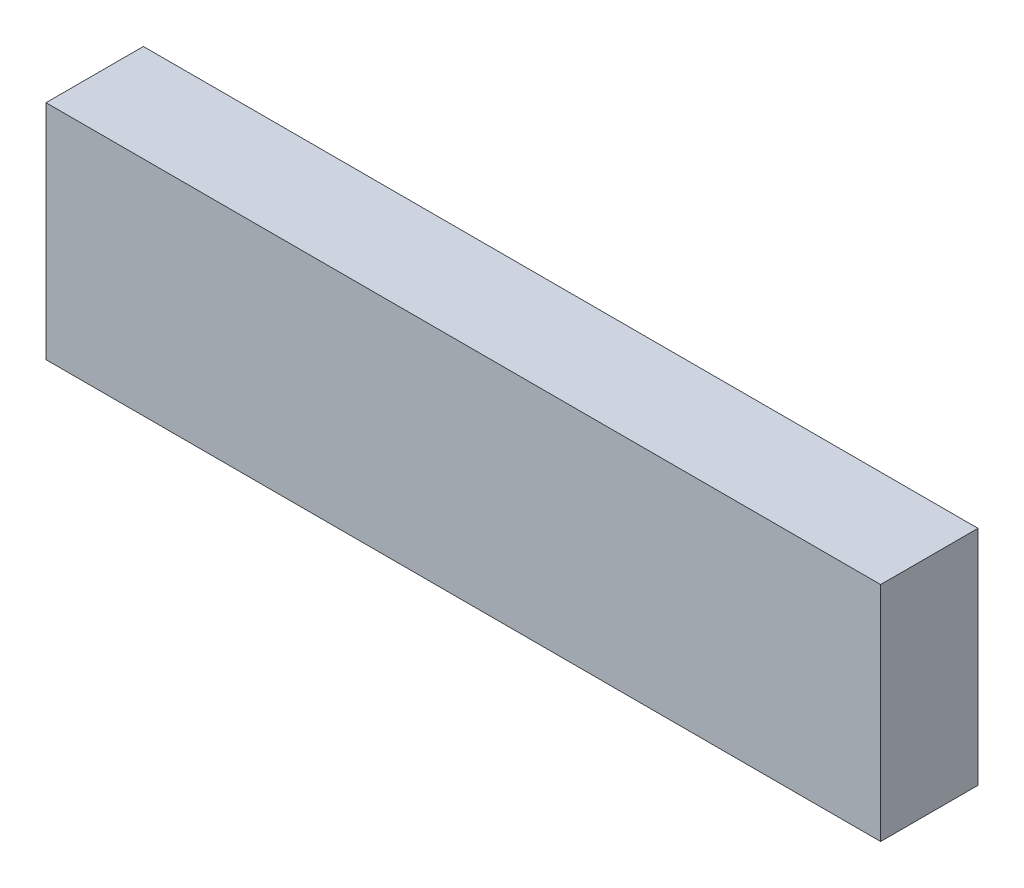
from build123d import *

# Parameters (mm, degrees)
SKETCH3_W           = 30
SKETCH3_H           = 8
BOSS_EXTRUDE4_DEPTH = 3.5
CUT_EXTRUDE2_DEPTH  = 0.02


with BuildPart() as part:
    # Sketch3 → Boss-Extrude4 (new body)
    with BuildSketch(Plane.XY):
        with Locations((2.893019553, -5.891239816)):
            Rectangle(SKETCH3_W, SKETCH3_H)
    extrude(amount=BOSS_EXTRUDE4_DEPTH)

    # Model → Cut-Extrude2 (cut)
    with BuildSketch(Plane.XY):
        with BuildLine():
            Line((13.27998025, -3.177456688), (13.27998025, -3.552456688))
            Line((13.27998025, -3.552456688), (13.479979466, -3.552456688))
            Line((13.479979466, -3.552456688), (13.579979466, -3.552456688))
            Line((13.579979466, -3.552456688), (13.579979466, -4.307456688))
            Line((13.579979466, -4.307456688), (13.779979466, -4.307456688))
            Line((13.779979466, -4.307456688), (13.879979466, -4.307456688))
            Line((13.879979466, -4.307456688), (13.879979466, -5.807456688))
            Line((13.879979466, -5.807456688), (15.925349871, -5.810472551))
            Line((15.925349871, -5.810472551), (16.204638871, -5.810472551))
            Line((16.204638871, -5.810472551), (16.007151871, -5.612985551))
            Line((16.007151871, -5.612985551), (16.077862871, -5.542274551))
            Line((16.077862871, -5.542274551), (16.275349871, -5.739761551))
            Line((16.275349871, -5.739761551), (16.275349871, -5.460472551))
            Line((16.275349871, -5.460472551), (16.375349871, -5.460472551))
            Line((16.375349871, -5.460472551), (16.375349871, -5.739759758))
            Line((16.375349871, -5.739759758), (16.572837871, -5.542274551))
            Line((16.572837871, -5.542274551), (16.643548371, -5.612985051))
            Line((16.643548371, -5.612985051), (16.446059975, -5.810473447))
            Line((16.446059975, -5.810473447), (16.725349871, -5.810473447))
            Line((16.725349871, -5.810473447), (16.725349871, -5.910474778))
            Line((16.725349871, -5.910474778), (16.446059871, -5.910474778))
            Line((16.446059871, -5.910474778), (16.643547871, -6.107962778))
            Line((16.643547871, -6.107962778), (16.572837871, -6.178672778))
            Line((16.572837871, -6.178672778), (16.375349871, -5.981184778))
            Line((16.375349871, -5.981184778), (16.375349871, -6.260474778))
            Line((16.375349871, -6.260474778), (16.275349871, -6.260474778))
            Line((16.275349871, -6.260474778), (16.275349871, -5.981182985))
            Line((16.275349871, -5.981182985), (16.077862871, -6.178672778))
            Line((16.077862871, -6.178672778), (16.007151871, -6.107962778))
            Line((16.007151871, -6.107962778), (16.204637079, -5.910474778))
            Line((16.204637079, -5.910474778), (16.05204189, -5.910532403))
            Line((16.05204189, -5.910532403), (13.879979466, -5.907458915))
            Line((13.879979466, -5.907458915), (13.879979466, -7.407458915))
            Line((13.879979466, -7.407458915), (13.779979466, -7.407458915))
            Line((13.779979466, -7.407458915), (13.579979466, -7.407458915))
            Line((13.579979466, -7.407458915), (13.579979466, -8.152458915))
            Line((13.579979466, -8.152458915), (13.479979466, -8.152458915))
            Line((13.479979466, -8.152458915), (13.279979466, -8.152458915))
            Line((13.279979466, -8.152458915), (13.279979466, -8.536818053))
            Line((13.279979466, -8.536818053), (13.17998025, -8.536818053))
            Line((13.17998025, -8.536818053), (12.762954936, -8.536818053))
            Line((12.762954936, -8.536818053), (12.762954936, -8.677291193))
            ThreePointArc((12.762954936, -8.677291193), (12.712142451, -8.95115883), (12.662877825, -8.677008528))
            Line((12.662877825, -8.677008528), (12.662877825, -8.536818053))
            Line((12.662877825, -8.536818053), (12.339954936, -8.536818053))
            Line((12.339954936, -8.536818053), (12.339954936, -8.677291193))
            ThreePointArc((12.339954936, -8.677291193), (12.289142451, -8.95115883), (12.239877825, -8.677008528))
            Line((12.239877825, -8.677008528), (12.239877825, -8.536818053))
            Line((12.239877825, -8.536818053), (11.916954936, -8.536818053))
            Line((11.916954936, -8.536818053), (11.916954936, -8.677291193))
            ThreePointArc((11.916954936, -8.677291193), (11.866142451, -8.95115883), (11.816877825, -8.677008528))
            Line((11.816877825, -8.677008528), (11.816877825, -8.536818053))
            Line((11.816877825, -8.536818053), (11.493954936, -8.536818053))
            Line((11.493954936, -8.536818053), (11.493954936, -8.677291193))
            ThreePointArc((11.493954936, -8.677291193), (11.443142451, -8.95115883), (11.393877825, -8.677008528))
            Line((11.393877825, -8.677008528), (11.393877825, -8.536818053))
            Line((11.393877825, -8.536818053), (11.070954936, -8.536818053))
            Line((11.070954936, -8.536818053), (11.070954936, -8.677291193))
            ThreePointArc((11.070954936, -8.677291193), (11.020142451, -8.95115883), (10.970877825, -8.677008528))
            Line((10.970877825, -8.677008528), (10.970877825, -8.536818053))
            Line((10.970877825, -8.536818053), (10.647954936, -8.536818053))
            Line((10.647954936, -8.536818053), (10.647954936, -8.677291193))
            ThreePointArc((10.647954936, -8.677291193), (10.597142451, -8.95115883), (10.547877825, -8.677008528))
            Line((10.547877825, -8.677008528), (10.547877825, -8.536818053))
            Line((10.547877825, -8.536818053), (10.224954936, -8.536818053))
            Line((10.224954936, -8.536818053), (10.224954936, -8.677291193))
            ThreePointArc((10.224954936, -8.677291193), (10.174142451, -8.95115883), (10.124877825, -8.677008528))
            Line((10.124877825, -8.677008528), (10.124877825, -8.536818053))
            Line((10.124877825, -8.536818053), (9.801954936, -8.536818053))
            Line((9.801954936, -8.536818053), (9.801954936, -8.677291193))
            ThreePointArc((9.801954936, -8.677291193), (9.751142451, -8.95115883), (9.701877825, -8.677008528))
            Line((9.701877825, -8.677008528), (9.701877825, -8.536818053))
            Line((9.701877825, -8.536818053), (9.378954936, -8.536818053))
            Line((9.378954936, -8.536818053), (9.378954936, -8.677291193))
            ThreePointArc((9.378954936, -8.677291193), (9.328142451, -8.95115883), (9.278877825, -8.677008528))
            Line((9.278877825, -8.677008528), (9.278877825, -8.536818053))
            Line((9.278877825, -8.536818053), (8.955954936, -8.536818053))
            Line((8.955954936, -8.536818053), (8.955954936, -8.677291193))
            ThreePointArc((8.955954936, -8.677291193), (8.905142451, -8.95115883), (8.855877825, -8.677008528))
            Line((8.855877825, -8.677008528), (8.855877825, -8.536818053))
            Line((8.855877825, -8.536818053), (8.532954936, -8.536818053))
            Line((8.532954936, -8.536818053), (8.532954936, -8.677291193))
            ThreePointArc((8.532954936, -8.677291193), (8.482142451, -8.95115883), (8.432877825, -8.677008528))
            Line((8.432877825, -8.677008528), (8.432877825, -8.536818053))
            Line((8.432877825, -8.536818053), (8.109954936, -8.536818053))
            Line((8.109954936, -8.536818053), (8.109954936, -8.677291193))
            ThreePointArc((8.109954936, -8.677291193), (8.059142451, -8.95115883), (8.009877825, -8.677008528))
            Line((8.009877825, -8.677008528), (8.009877825, -8.536818053))
            Line((8.009877825, -8.536818053), (7.686954936, -8.536818053))
            Line((7.686954936, -8.536818053), (7.686954936, -8.677291193))
            ThreePointArc((7.686954936, -8.677291193), (7.636142451, -8.95115883), (7.586877825, -8.677008528))
            Line((7.586877825, -8.677008528), (7.586877825, -8.536818053))
            Line((7.586877825, -8.536818053), (7.263954936, -8.536818053))
            Line((7.263954936, -8.536818053), (7.263954936, -8.677291193))
            ThreePointArc((7.263954936, -8.677291193), (7.213142451, -8.95115883), (7.163877825, -8.677008528))
            Line((7.163877825, -8.677008528), (7.163877825, -8.536818053))
            Line((7.163877825, -8.536818053), (6.840954936, -8.536818053))
            Line((6.840954936, -8.536818053), (6.840954936, -8.677291193))
            ThreePointArc((6.840954936, -8.677291193), (6.790142451, -8.95115883), (6.740877825, -8.677008528))
            Line((6.740877825, -8.677008528), (6.740877825, -8.536818053))
            Line((6.740877825, -8.536818053), (6.417954936, -8.536818053))
            Line((6.417954936, -8.536818053), (6.417954936, -8.677291193))
            ThreePointArc((6.417954936, -8.677291193), (6.367142451, -8.95115883), (6.317877825, -8.677008528))
            Line((6.317877825, -8.677008528), (6.317877825, -8.536818053))
            Line((6.317877825, -8.536818053), (5.994954936, -8.536818053))
            Line((5.994954936, -8.536818053), (5.994954936, -8.677291193))
            ThreePointArc((5.994954936, -8.677291193), (5.944142451, -8.95115883), (5.894877825, -8.677008528))
            Line((5.894877825, -8.677008528), (5.894877825, -8.536818053))
            Line((5.894877825, -8.536818053), (5.571954936, -8.536818053))
            Line((5.571954936, -8.536818053), (5.571954936, -8.677291193))
            ThreePointArc((5.571954936, -8.677291193), (5.521142451, -8.95115883), (5.471877825, -8.677008528))
            Line((5.471877825, -8.677008528), (5.471877825, -8.536818053))
            Line((5.471877825, -8.536818053), (5.148954936, -8.536818053))
            Line((5.148954936, -8.536818053), (5.148954936, -8.677291193))
            ThreePointArc((5.148954936, -8.677291193), (5.098142451, -8.95115883), (5.048877825, -8.677008528))
            Line((5.048877825, -8.677008528), (5.048877825, -8.536818053))
            Line((5.048877825, -8.536818053), (4.725954936, -8.536818053))
            Line((4.725954936, -8.536818053), (4.725954936, -8.677291193))
            ThreePointArc((4.725954936, -8.677291193), (4.675142451, -8.95115883), (4.625877825, -8.677008528))
            Line((4.625877825, -8.677008528), (4.625877825, -8.536818053))
            Line((4.625877825, -8.536818053), (4.302954936, -8.536818053))
            Line((4.302954936, -8.536818053), (4.302954936, -8.677291193))
            ThreePointArc((4.302954936, -8.677291193), (4.252142451, -8.95115883), (4.202877825, -8.677008528))
            Line((4.202877825, -8.677008528), (4.202877825, -8.536818053))
            Line((4.202877825, -8.536818053), (3.879954936, -8.536818053))
            Line((3.879954936, -8.536818053), (3.879954936, -8.677291193))
            ThreePointArc((3.879954936, -8.677291193), (3.829142451, -8.95115883), (3.779877825, -8.677008528))
            Line((3.779877825, -8.677008528), (3.779877825, -8.536818053))
            Line((3.779877825, -8.536818053), (3.456954936, -8.536818053))
            Line((3.456954936, -8.536818053), (3.456954936, -8.677291193))
            ThreePointArc((3.456954936, -8.677291193), (3.406142451, -8.95115883), (3.356877825, -8.677008528))
            Line((3.356877825, -8.677008528), (3.356877825, -8.536818053))
            Line((3.356877825, -8.536818053), (3.033954936, -8.536818053))
            Line((3.033954936, -8.536818053), (3.033954936, -8.677291193))
            ThreePointArc((3.033954936, -8.677291193), (2.983142451, -8.95115883), (2.933877825, -8.677008528))
            Line((2.933877825, -8.677008528), (2.933877825, -8.536818053))
            Line((2.933877825, -8.536818053), (2.610954936, -8.536818053))
            Line((2.610954936, -8.536818053), (2.610954936, -8.677291193))
            ThreePointArc((2.610954936, -8.677291193), (2.560142451, -8.95115883), (2.510877825, -8.677008528))
            Line((2.510877825, -8.677008528), (2.510877825, -8.536818053))
            Line((2.510877825, -8.536818053), (2.187954936, -8.536818053))
            Line((2.187954936, -8.536818053), (2.187954936, -8.677291193))
            ThreePointArc((2.187954936, -8.677291193), (2.137142451, -8.95115883), (2.087877825, -8.677008528))
            Line((2.087877825, -8.677008528), (2.087877825, -8.536818053))
            Line((2.087877825, -8.536818053), (1.764954936, -8.536818053))
            Line((1.764954936, -8.536818053), (1.764954936, -8.677291193))
            ThreePointArc((1.764954936, -8.677291193), (1.714142451, -8.95115883), (1.664877825, -8.677008528))
            Line((1.664877825, -8.677008528), (1.664877825, -8.536818053))
            Line((1.664877825, -8.536818053), (1.341954936, -8.536818053))
            Line((1.341954936, -8.536818053), (1.341954936, -8.677291193))
            ThreePointArc((1.341954936, -8.677291193), (1.291142451, -8.95115883), (1.241877825, -8.677008528))
            Line((1.241877825, -8.677008528), (1.241877825, -8.536818053))
            Line((1.241877825, -8.536818053), (0.918954936, -8.536818053))
            Line((0.918954936, -8.536818053), (0.918954936, -8.677291193))
            ThreePointArc((0.918954936, -8.677291193), (0.868142451, -8.95115883), (0.818877825, -8.677008528))
            Line((0.818877825, -8.677008528), (0.818877825, -8.536818053))
            Line((0.818877825, -8.536818053), (0.495954936, -8.536818053))
            Line((0.495954936, -8.536818053), (0.495954936, -8.677291193))
            ThreePointArc((0.495954936, -8.677291193), (0.445142451, -8.95115883), (0.395877825, -8.677008528))
            Line((0.395877825, -8.677008528), (0.395877825, -8.536818053))
            Line((0.395877825, -8.536818053), (0.072954936, -8.536818053))
            Line((0.072954936, -8.536818053), (0.072954936, -8.677291193))
            ThreePointArc((0.072954936, -8.677291193), (0.022142451, -8.95115883), (-0.027122175, -8.677008528))
            Line((-0.027122175, -8.677008528), (-0.027122175, -8.536818053))
            Line((-0.027122175, -8.536818053), (-0.350045064, -8.536818053))
            Line((-0.350045064, -8.536818053), (-0.350045064, -8.677291193))
            ThreePointArc((-0.350045064, -8.677291193), (-0.400857549, -8.95115883), (-0.450122175, -8.677008528))
            Line((-0.450122175, -8.677008528), (-0.450122175, -8.536818053))
            Line((-0.450122175, -8.536818053), (-0.773045064, -8.536818053))
            Line((-0.773045064, -8.536818053), (-0.773045064, -8.677291193))
            ThreePointArc((-0.773045064, -8.677291193), (-0.823857549, -8.95115883), (-0.873122175, -8.677008528))
            Line((-0.873122175, -8.677008528), (-0.873122175, -8.536818053))
            Line((-0.873122175, -8.536818053), (-1.196045064, -8.536818053))
            Line((-1.196045064, -8.536818053), (-1.196045064, -8.677291193))
            ThreePointArc((-1.196045064, -8.677291193), (-1.246857549, -8.95115883), (-1.296122175, -8.677008528))
            Line((-1.296122175, -8.677008528), (-1.296122175, -8.536818053))
            Line((-1.296122175, -8.536818053), (-1.619045064, -8.536818053))
            Line((-1.619045064, -8.536818053), (-1.619045064, -8.677291193))
            ThreePointArc((-1.619045064, -8.677291193), (-1.669857549, -8.95115883), (-1.719122175, -8.677008528))
            Line((-1.719122175, -8.677008528), (-1.719122175, -8.536818053))
            Line((-1.719122175, -8.536818053), (-2.042045064, -8.536818053))
            Line((-2.042045064, -8.536818053), (-2.042045064, -8.677291193))
            ThreePointArc((-2.042045064, -8.677291193), (-2.092857549, -8.95115883), (-2.142122175, -8.677008528))
            Line((-2.142122175, -8.677008528), (-2.142122175, -8.536818053))
            Line((-2.142122175, -8.536818053), (-2.465045064, -8.536818053))
            Line((-2.465045064, -8.536818053), (-2.465045064, -8.677291193))
            ThreePointArc((-2.465045064, -8.677291193), (-2.515857549, -8.95115883), (-2.565122175, -8.677008528))
            Line((-2.565122175, -8.677008528), (-2.565122175, -8.536818053))
            Line((-2.565122175, -8.536818053), (-2.888045064, -8.536818053))
            Line((-2.888045064, -8.536818053), (-2.888045064, -8.677291193))
            ThreePointArc((-2.888045064, -8.677291193), (-2.938857549, -8.95115883), (-2.988122175, -8.677008528))
            Line((-2.988122175, -8.677008528), (-2.988122175, -8.536818053))
            Line((-2.988122175, -8.536818053), (-3.311045064, -8.536818053))
            Line((-3.311045064, -8.536818053), (-3.311045064, -8.677291193))
            ThreePointArc((-3.311045064, -8.677291193), (-3.361857549, -8.95115883), (-3.411122175, -8.677008528))
            Line((-3.411122175, -8.677008528), (-3.411122175, -8.536818053))
            Line((-3.411122175, -8.536818053), (-3.734045064, -8.536818053))
            Line((-3.734045064, -8.536818053), (-3.734045064, -8.677291193))
            ThreePointArc((-3.734045064, -8.677291193), (-3.784857549, -8.95115883), (-3.834122175, -8.677008528))
            Line((-3.834122175, -8.677008528), (-3.834122175, -8.536818053))
            Line((-3.834122175, -8.536818053), (-4.157045064, -8.536818053))
            Line((-4.157045064, -8.536818053), (-4.157045064, -8.677291193))
            ThreePointArc((-4.157045064, -8.677291193), (-4.207857549, -8.95115883), (-4.257122175, -8.677008528))
            Line((-4.257122175, -8.677008528), (-4.257122175, -8.536818053))
            Line((-4.257122175, -8.536818053), (-4.580045064, -8.536818053))
            Line((-4.580045064, -8.536818053), (-4.580045064, -8.677291193))
            ThreePointArc((-4.580045064, -8.677291193), (-4.630857549, -8.95115883), (-4.680122175, -8.677008528))
            Line((-4.680122175, -8.677008528), (-4.680122175, -8.536818053))
            Line((-4.680122175, -8.536818053), (-5.003045064, -8.536818053))
            Line((-5.003045064, -8.536818053), (-5.003045064, -8.677291193))
            ThreePointArc((-5.003045064, -8.677291193), (-5.053857549, -8.95115883), (-5.103122175, -8.677008528))
            Line((-5.103122175, -8.677008528), (-5.103122175, -8.536818053))
            Line((-5.103122175, -8.536818053), (-5.426045064, -8.536818053))
            Line((-5.426045064, -8.536818053), (-5.426045064, -8.677291193))
            ThreePointArc((-5.426045064, -8.677291193), (-5.476857549, -8.95115883), (-5.526122175, -8.677008528))
            Line((-5.526122175, -8.677008528), (-5.526122175, -8.536818053))
            Line((-5.526122175, -8.536818053), (-5.849045064, -8.536818053))
            Line((-5.849045064, -8.536818053), (-5.849045064, -8.677291193))
            ThreePointArc((-5.849045064, -8.677291193), (-5.899857549, -8.95115883), (-5.949122175, -8.677008528))
            Line((-5.949122175, -8.677008528), (-5.949122175, -8.536818053))
            Line((-5.949122175, -8.536818053), (-6.272045064, -8.536818053))
            Line((-6.272045064, -8.536818053), (-6.272045064, -8.677291193))
            ThreePointArc((-6.272045064, -8.677291193), (-6.322857549, -8.95115883), (-6.372122175, -8.677008528))
            Line((-6.372122175, -8.677008528), (-6.372122175, -8.536818053))
            Line((-6.372122175, -8.536818053), (-6.695045064, -8.536818053))
            Line((-6.695045064, -8.536818053), (-6.695045064, -8.677291193))
            ThreePointArc((-6.695045064, -8.677291193), (-6.745857549, -8.95115883), (-6.795122175, -8.677008528))
            Line((-6.795122175, -8.677008528), (-6.795122175, -8.536818053))
            Line((-6.795122175, -8.536818053), (-7.118045064, -8.536818053))
            Line((-7.118045064, -8.536818053), (-7.118045064, -8.677291193))
            ThreePointArc((-7.118045064, -8.677291193), (-7.168857549, -8.95115883), (-7.218122175, -8.677008528))
            Line((-7.218122175, -8.677008528), (-7.218122175, -8.536818053))
            Line((-7.218122175, -8.536818053), (-7.583044182, -8.536986729))
            Line((-7.583044182, -8.536986729), (-7.683044182, -8.536986729))
            Line((-7.683044182, -8.536986729), (-7.683044182, -8.161986729))
            Line((-7.683044182, -8.161986729), (-7.883044182, -8.161986729))
            Line((-7.883044182, -8.161986729), (-7.983044182, -8.161986729))
            Line((-7.983044182, -8.161986729), (-7.983044182, -7.416986729))
            Line((-7.983044182, -7.416986729), (-8.283044682, -7.416986729))
            Line((-8.283044682, -7.416986729), (-8.283044682, -5.907458515))
            Line((-8.283044682, -5.907458515), (-10.454849515, -5.904385361))
            Line((-10.454849515, -5.904385361), (-10.608080655, -5.904563734))
            Line((-10.608080655, -5.904563734), (-10.410592655, -6.102051734))
            Line((-10.410592655, -6.102051734), (-10.481302655, -6.172761734))
            Line((-10.481302655, -6.172761734), (-10.678790655, -5.975273734))
            Line((-10.678790655, -5.975273734), (-10.678790655, -6.254563234))
            Line((-10.678790655, -6.254563234), (-10.778790155, -6.254563234))
            Line((-10.778790155, -6.254563234), (-10.778790155, -5.975273885))
            Line((-10.778790155, -5.975273885), (-10.976278377, -6.172760012))
            Line((-10.976278377, -6.172760012), (-11.046988939, -6.102049574))
            Line((-11.046988939, -6.102049574), (-10.849501288, -5.904561574))
            Line((-10.849501288, -5.904561574), (-11.128790939, -5.904561574))
            Line((-11.128790939, -5.904561574), (-11.128790939, -5.804561574))
            Line((-11.128790939, -5.804561574), (-10.849501939, -5.804561574))
            Line((-10.849501939, -5.804561574), (-11.046988939, -5.607074574))
            Line((-11.046988939, -5.607074574), (-10.976277939, -5.536363574))
            Line((-10.976277939, -5.536363574), (-10.778790939, -5.733850574))
            Line((-10.778790939, -5.733850574), (-10.778790939, -5.454561574))
            Line((-10.778790939, -5.454561574), (-10.678790939, -5.454561574))
            Line((-10.678790939, -5.454561574), (-10.678790939, -5.733851225))
            Line((-10.678790939, -5.733851225), (-10.481302939, -5.536363574))
            Line((-10.481302939, -5.536363574), (-10.410592939, -5.607074574))
            Line((-10.410592939, -5.607074574), (-10.608082732, -5.804561574))
            Line((-10.608082732, -5.804561574), (-10.454849799, -5.8043832))
            Line((-10.454849799, -5.8043832), (-8.283044966, -5.807456324))
            Line((-8.283044966, -5.807456324), (-8.283044966, -4.316984538))
            Line((-8.283044966, -4.316984538), (-8.183044966, -4.316984538))
            Line((-8.183044966, -4.316984538), (-7.983044966, -4.316984538))
            Line((-7.983044966, -4.316984538), (-7.983044966, -3.561984538))
            Line((-7.983044966, -3.561984538), (-7.883044182, -3.561984538))
            Line((-7.883044182, -3.561984538), (-7.683044182, -3.561984538))
            Line((-7.683044182, -3.561984538), (-7.683044182, -3.186984538))
            Line((-7.683044182, -3.186984538), (-7.583044182, -3.186984538))
            Line((-7.583044182, -3.186984538), (13.17998025, -3.177456688))
            Line((13.17998025, -3.177456688), (13.27998025, -3.177456688))
        make_face()
        with BuildLine():
            Line((-7.218122175, -3.286818053), (-7.583044182, -3.286986729))
            Line((-7.583044182, -3.286986729), (-7.583044182, -3.936986729))
            Line((-7.583044182, -3.936986729), (13.17998025, -3.927458879))
            Line((13.17998025, -3.927458879), (13.17998025, -3.652458879))
            Line((13.17998025, -3.652458879), (13.17998025, -3.552458879))
            Line((13.17998025, -3.552458879), (13.17998025, -3.286818053))
            Line((13.17998025, -3.286818053), (12.762954936, -3.286818053))
            Line((12.762954936, -3.286818053), (12.762954936, -3.427291193))
            ThreePointArc((12.762954936, -3.427291193), (12.712142451, -3.70115883), (12.662877825, -3.427008528))
            Line((12.662877825, -3.427008528), (12.662877825, -3.286818053))
            Line((12.662877825, -3.286818053), (12.339954936, -3.286818053))
            Line((12.339954936, -3.286818053), (12.339954936, -3.427291193))
            ThreePointArc((12.339954936, -3.427291193), (12.289142451, -3.70115883), (12.239877825, -3.427008528))
            Line((12.239877825, -3.427008528), (12.239877825, -3.286818053))
            Line((12.239877825, -3.286818053), (11.916954936, -3.286818053))
            Line((11.916954936, -3.286818053), (11.916954936, -3.427291193))
            ThreePointArc((11.916954936, -3.427291193), (11.866142451, -3.70115883), (11.816877825, -3.427008528))
            Line((11.816877825, -3.427008528), (11.816877825, -3.286818053))
            Line((11.816877825, -3.286818053), (11.493954936, -3.286818053))
            Line((11.493954936, -3.286818053), (11.493954936, -3.427291193))
            ThreePointArc((11.493954936, -3.427291193), (11.443142451, -3.70115883), (11.393877825, -3.427008528))
            Line((11.393877825, -3.427008528), (11.393877825, -3.286818053))
            Line((11.393877825, -3.286818053), (11.070954936, -3.286818053))
            Line((11.070954936, -3.286818053), (11.070954936, -3.427291193))
            ThreePointArc((11.070954936, -3.427291193), (11.020142451, -3.70115883), (10.970877825, -3.427008528))
            Line((10.970877825, -3.427008528), (10.970877825, -3.286818053))
            Line((10.970877825, -3.286818053), (10.647954936, -3.286818053))
            Line((10.647954936, -3.286818053), (10.647954936, -3.427291193))
            ThreePointArc((10.647954936, -3.427291193), (10.597142451, -3.70115883), (10.547877825, -3.427008528))
            Line((10.547877825, -3.427008528), (10.547877825, -3.286818053))
            Line((10.547877825, -3.286818053), (10.224954936, -3.286818053))
            Line((10.224954936, -3.286818053), (10.224954936, -3.427291193))
            ThreePointArc((10.224954936, -3.427291193), (10.174142451, -3.70115883), (10.124877825, -3.427008528))
            Line((10.124877825, -3.427008528), (10.124877825, -3.286818053))
            Line((10.124877825, -3.286818053), (9.801954936, -3.286818053))
            Line((9.801954936, -3.286818053), (9.801954936, -3.427291193))
            ThreePointArc((9.801954936, -3.427291193), (9.751142451, -3.70115883), (9.701877825, -3.427008528))
            Line((9.701877825, -3.427008528), (9.701877825, -3.286818053))
            Line((9.701877825, -3.286818053), (9.378954936, -3.286818053))
            Line((9.378954936, -3.286818053), (9.378954936, -3.427291193))
            ThreePointArc((9.378954936, -3.427291193), (9.328142451, -3.70115883), (9.278877825, -3.427008528))
            Line((9.278877825, -3.427008528), (9.278877825, -3.286818053))
            Line((9.278877825, -3.286818053), (8.955954936, -3.286818053))
            Line((8.955954936, -3.286818053), (8.955954936, -3.427291193))
            ThreePointArc((8.955954936, -3.427291193), (8.905142451, -3.70115883), (8.855877825, -3.427008528))
            Line((8.855877825, -3.427008528), (8.855877825, -3.286818053))
            Line((8.855877825, -3.286818053), (8.532954936, -3.286818053))
            Line((8.532954936, -3.286818053), (8.532954936, -3.427291193))
            ThreePointArc((8.532954936, -3.427291193), (8.482142451, -3.70115883), (8.432877825, -3.427008528))
            Line((8.432877825, -3.427008528), (8.432877825, -3.286818053))
            Line((8.432877825, -3.286818053), (8.109954936, -3.286818053))
            Line((8.109954936, -3.286818053), (8.109954936, -3.427291193))
            ThreePointArc((8.109954936, -3.427291193), (8.059142451, -3.70115883), (8.009877825, -3.427008528))
            Line((8.009877825, -3.427008528), (8.009877825, -3.286818053))
            Line((8.009877825, -3.286818053), (7.686954936, -3.286818053))
            Line((7.686954936, -3.286818053), (7.686954936, -3.427291193))
            ThreePointArc((7.686954936, -3.427291193), (7.636142451, -3.70115883), (7.586877825, -3.427008528))
            Line((7.586877825, -3.427008528), (7.586877825, -3.286818053))
            Line((7.586877825, -3.286818053), (7.263954936, -3.286818053))
            Line((7.263954936, -3.286818053), (7.263954936, -3.427291193))
            ThreePointArc((7.263954936, -3.427291193), (7.213142451, -3.70115883), (7.163877825, -3.427008528))
            Line((7.163877825, -3.427008528), (7.163877825, -3.286818053))
            Line((7.163877825, -3.286818053), (6.840954936, -3.286818053))
            Line((6.840954936, -3.286818053), (6.840954936, -3.427291193))
            ThreePointArc((6.840954936, -3.427291193), (6.790142451, -3.70115883), (6.740877825, -3.427008528))
            Line((6.740877825, -3.427008528), (6.740877825, -3.286818053))
            Line((6.740877825, -3.286818053), (6.417954936, -3.286818053))
            Line((6.417954936, -3.286818053), (6.417954936, -3.427291193))
            ThreePointArc((6.417954936, -3.427291193), (6.367142451, -3.70115883), (6.317877825, -3.427008528))
            Line((6.317877825, -3.427008528), (6.317877825, -3.286818053))
            Line((6.317877825, -3.286818053), (5.994954936, -3.286818053))
            Line((5.994954936, -3.286818053), (5.994954936, -3.427291193))
            ThreePointArc((5.994954936, -3.427291193), (5.944142451, -3.70115883), (5.894877825, -3.427008528))
            Line((5.894877825, -3.427008528), (5.894877825, -3.286818053))
            Line((5.894877825, -3.286818053), (5.571954936, -3.286818053))
            Line((5.571954936, -3.286818053), (5.571954936, -3.427291193))
            ThreePointArc((5.571954936, -3.427291193), (5.521142451, -3.70115883), (5.471877825, -3.427008528))
            Line((5.471877825, -3.427008528), (5.471877825, -3.286818053))
            Line((5.471877825, -3.286818053), (5.148954936, -3.286818053))
            Line((5.148954936, -3.286818053), (5.148954936, -3.427291193))
            ThreePointArc((5.148954936, -3.427291193), (5.098142451, -3.70115883), (5.048877825, -3.427008528))
            Line((5.048877825, -3.427008528), (5.048877825, -3.286818053))
            Line((5.048877825, -3.286818053), (4.725954936, -3.286818053))
            Line((4.725954936, -3.286818053), (4.725954936, -3.427291193))
            ThreePointArc((4.725954936, -3.427291193), (4.675142451, -3.70115883), (4.625877825, -3.427008528))
            Line((4.625877825, -3.427008528), (4.625877825, -3.286818053))
            Line((4.625877825, -3.286818053), (4.302954936, -3.286818053))
            Line((4.302954936, -3.286818053), (4.302954936, -3.427291193))
            ThreePointArc((4.302954936, -3.427291193), (4.252142451, -3.70115883), (4.202877825, -3.427008528))
            Line((4.202877825, -3.427008528), (4.202877825, -3.286818053))
            Line((4.202877825, -3.286818053), (3.879954936, -3.286818053))
            Line((3.879954936, -3.286818053), (3.879954936, -3.427291193))
            ThreePointArc((3.879954936, -3.427291193), (3.829142451, -3.70115883), (3.779877825, -3.427008528))
            Line((3.779877825, -3.427008528), (3.779877825, -3.286818053))
            Line((3.779877825, -3.286818053), (3.456954936, -3.286818053))
            Line((3.456954936, -3.286818053), (3.456954936, -3.427291193))
            ThreePointArc((3.456954936, -3.427291193), (3.406142451, -3.70115883), (3.356877825, -3.427008528))
            Line((3.356877825, -3.427008528), (3.356877825, -3.286818053))
            Line((3.356877825, -3.286818053), (3.033954936, -3.286818053))
            Line((3.033954936, -3.286818053), (3.033954936, -3.427291193))
            ThreePointArc((3.033954936, -3.427291193), (2.983142451, -3.70115883), (2.933877825, -3.427008528))
            Line((2.933877825, -3.427008528), (2.933877825, -3.286818053))
            Line((2.933877825, -3.286818053), (2.610954936, -3.286818053))
            Line((2.610954936, -3.286818053), (2.610954936, -3.427291193))
            ThreePointArc((2.610954936, -3.427291193), (2.560142451, -3.70115883), (2.510877825, -3.427008528))
            Line((2.510877825, -3.427008528), (2.510877825, -3.286818053))
            Line((2.510877825, -3.286818053), (2.187954936, -3.286818053))
            Line((2.187954936, -3.286818053), (2.187954936, -3.427291193))
            ThreePointArc((2.187954936, -3.427291193), (2.137142451, -3.70115883), (2.087877825, -3.427008528))
            Line((2.087877825, -3.427008528), (2.087877825, -3.286818053))
            Line((2.087877825, -3.286818053), (1.764954936, -3.286818053))
            Line((1.764954936, -3.286818053), (1.764954936, -3.427291193))
            ThreePointArc((1.764954936, -3.427291193), (1.714142451, -3.70115883), (1.664877825, -3.427008528))
            Line((1.664877825, -3.427008528), (1.664877825, -3.286818053))
            Line((1.664877825, -3.286818053), (1.341954936, -3.286818053))
            Line((1.341954936, -3.286818053), (1.341954936, -3.427291193))
            ThreePointArc((1.341954936, -3.427291193), (1.291142451, -3.70115883), (1.241877825, -3.427008528))
            Line((1.241877825, -3.427008528), (1.241877825, -3.286818053))
            Line((1.241877825, -3.286818053), (0.918954936, -3.286818053))
            Line((0.918954936, -3.286818053), (0.918954936, -3.427291193))
            ThreePointArc((0.918954936, -3.427291193), (0.868142451, -3.70115883), (0.818877825, -3.427008528))
            Line((0.818877825, -3.427008528), (0.818877825, -3.286818053))
            Line((0.818877825, -3.286818053), (0.495954936, -3.286818053))
            Line((0.495954936, -3.286818053), (0.495954936, -3.427291193))
            ThreePointArc((0.495954936, -3.427291193), (0.445142451, -3.70115883), (0.395877825, -3.427008528))
            Line((0.395877825, -3.427008528), (0.395877825, -3.286818053))
            Line((0.395877825, -3.286818053), (0.072954936, -3.286818053))
            Line((0.072954936, -3.286818053), (0.072954936, -3.427291193))
            ThreePointArc((0.072954936, -3.427291193), (0.022142451, -3.70115883), (-0.027122175, -3.427008528))
            Line((-0.027122175, -3.427008528), (-0.027122175, -3.286818053))
            Line((-0.027122175, -3.286818053), (-0.350045064, -3.286818053))
            Line((-0.350045064, -3.286818053), (-0.350045064, -3.427291193))
            ThreePointArc((-0.350045064, -3.427291193), (-0.400857549, -3.70115883), (-0.450122175, -3.427008528))
            Line((-0.450122175, -3.427008528), (-0.450122175, -3.286818053))
            Line((-0.450122175, -3.286818053), (-0.773045064, -3.286818053))
            Line((-0.773045064, -3.286818053), (-0.773045064, -3.427291193))
            ThreePointArc((-0.773045064, -3.427291193), (-0.823857549, -3.70115883), (-0.873122175, -3.427008528))
            Line((-0.873122175, -3.427008528), (-0.873122175, -3.286818053))
            Line((-0.873122175, -3.286818053), (-1.196045064, -3.286818053))
            Line((-1.196045064, -3.286818053), (-1.196045064, -3.427291193))
            ThreePointArc((-1.196045064, -3.427291193), (-1.246857549, -3.70115883), (-1.296122175, -3.427008528))
            Line((-1.296122175, -3.427008528), (-1.296122175, -3.286818053))
            Line((-1.296122175, -3.286818053), (-1.619045064, -3.286818053))
            Line((-1.619045064, -3.286818053), (-1.619045064, -3.427291193))
            ThreePointArc((-1.619045064, -3.427291193), (-1.669857549, -3.70115883), (-1.719122175, -3.427008528))
            Line((-1.719122175, -3.427008528), (-1.719122175, -3.286818053))
            Line((-1.719122175, -3.286818053), (-2.042045064, -3.286818053))
            Line((-2.042045064, -3.286818053), (-2.042045064, -3.427291193))
            ThreePointArc((-2.042045064, -3.427291193), (-2.092857549, -3.70115883), (-2.142122175, -3.427008528))
            Line((-2.142122175, -3.427008528), (-2.142122175, -3.286818053))
            Line((-2.142122175, -3.286818053), (-2.465045064, -3.286818053))
            Line((-2.465045064, -3.286818053), (-2.465045064, -3.427291193))
            ThreePointArc((-2.465045064, -3.427291193), (-2.515857549, -3.70115883), (-2.565122175, -3.427008528))
            Line((-2.565122175, -3.427008528), (-2.565122175, -3.286818053))
            Line((-2.565122175, -3.286818053), (-2.888045064, -3.286818053))
            Line((-2.888045064, -3.286818053), (-2.888045064, -3.427291193))
            ThreePointArc((-2.888045064, -3.427291193), (-2.938857549, -3.70115883), (-2.988122175, -3.427008528))
            Line((-2.988122175, -3.427008528), (-2.988122175, -3.286818053))
            Line((-2.988122175, -3.286818053), (-3.311045064, -3.286818053))
            Line((-3.311045064, -3.286818053), (-3.311045064, -3.427291193))
            ThreePointArc((-3.311045064, -3.427291193), (-3.361857549, -3.70115883), (-3.411122175, -3.427008528))
            Line((-3.411122175, -3.427008528), (-3.411122175, -3.286818053))
            Line((-3.411122175, -3.286818053), (-3.734045064, -3.286818053))
            Line((-3.734045064, -3.286818053), (-3.734045064, -3.427291193))
            ThreePointArc((-3.734045064, -3.427291193), (-3.784857549, -3.70115883), (-3.834122175, -3.427008528))
            Line((-3.834122175, -3.427008528), (-3.834122175, -3.286818053))
            Line((-3.834122175, -3.286818053), (-4.157045064, -3.286818053))
            Line((-4.157045064, -3.286818053), (-4.157045064, -3.427291193))
            ThreePointArc((-4.157045064, -3.427291193), (-4.207857549, -3.70115883), (-4.257122175, -3.427008528))
            Line((-4.257122175, -3.427008528), (-4.257122175, -3.286818053))
            Line((-4.257122175, -3.286818053), (-4.580045064, -3.286818053))
            Line((-4.580045064, -3.286818053), (-4.580045064, -3.427291193))
            ThreePointArc((-4.580045064, -3.427291193), (-4.630857549, -3.70115883), (-4.680122175, -3.427008528))
            Line((-4.680122175, -3.427008528), (-4.680122175, -3.286818053))
            Line((-4.680122175, -3.286818053), (-5.003045064, -3.286818053))
            Line((-5.003045064, -3.286818053), (-5.003045064, -3.427291193))
            ThreePointArc((-5.003045064, -3.427291193), (-5.053857549, -3.70115883), (-5.103122175, -3.427008528))
            Line((-5.103122175, -3.427008528), (-5.103122175, -3.286818053))
            Line((-5.103122175, -3.286818053), (-5.426045064, -3.286818053))
            Line((-5.426045064, -3.286818053), (-5.426045064, -3.427291193))
            ThreePointArc((-5.426045064, -3.427291193), (-5.476857549, -3.70115883), (-5.526122175, -3.427008528))
            Line((-5.526122175, -3.427008528), (-5.526122175, -3.286818053))
            Line((-5.526122175, -3.286818053), (-5.849045064, -3.286818053))
            Line((-5.849045064, -3.286818053), (-5.849045064, -3.427291193))
            ThreePointArc((-5.849045064, -3.427291193), (-5.899857549, -3.70115883), (-5.949122175, -3.427008528))
            Line((-5.949122175, -3.427008528), (-5.949122175, -3.286818053))
            Line((-5.949122175, -3.286818053), (-6.272045064, -3.286818053))
            Line((-6.272045064, -3.286818053), (-6.272045064, -3.427291193))
            ThreePointArc((-6.272045064, -3.427291193), (-6.322857549, -3.70115883), (-6.372122175, -3.427008528))
            Line((-6.372122175, -3.427008528), (-6.372122175, -3.286818053))
            Line((-6.372122175, -3.286818053), (-6.695045064, -3.286818053))
            Line((-6.695045064, -3.286818053), (-6.695045064, -3.427291193))
            ThreePointArc((-6.695045064, -3.427291193), (-6.745857549, -3.70115883), (-6.795122175, -3.427008528))
            Line((-6.795122175, -3.427008528), (-6.795122175, -3.286818053))
            Line((-6.795122175, -3.286818053), (-7.118045064, -3.286818053))
            Line((-7.118045064, -3.286818053), (-7.118045064, -3.427291193))
            ThreePointArc((-7.118045064, -3.427291193), (-7.168857549, -3.70115883), (-7.218122175, -3.427008528))
            Line((-7.218122175, -3.427008528), (-7.218122175, -3.286818053))
        make_face(mode=Mode.SUBTRACT)
        with BuildLine():
            Line((-7.118045064, -4.177291193), (-7.118045064, -4.036818053))
            Line((-7.118045064, -4.036818053), (-6.795122175, -4.036818053))
            Line((-6.795122175, -4.036818053), (-6.795122175, -4.177008528))
            ThreePointArc((-6.795122175, -4.177008528), (-6.745857549, -4.45115883), (-6.695045064, -4.177291193))
            Line((-6.695045064, -4.177291193), (-6.695045064, -4.036818053))
            Line((-6.695045064, -4.036818053), (-6.372122175, -4.036818053))
            Line((-6.372122175, -4.036818053), (-6.372122175, -4.177008528))
            ThreePointArc((-6.372122175, -4.177008528), (-6.322857549, -4.45115883), (-6.272045064, -4.177291193))
            Line((-6.272045064, -4.177291193), (-6.272045064, -4.036818053))
            Line((-6.272045064, -4.036818053), (-5.949122175, -4.036818053))
            Line((-5.949122175, -4.036818053), (-5.949122175, -4.177008528))
            ThreePointArc((-5.949122175, -4.177008528), (-5.899857549, -4.45115883), (-5.849045064, -4.177291193))
            Line((-5.849045064, -4.177291193), (-5.849045064, -4.036818053))
            Line((-5.849045064, -4.036818053), (-5.526122175, -4.036818053))
            Line((-5.526122175, -4.036818053), (-5.526122175, -4.177008528))
            ThreePointArc((-5.526122175, -4.177008528), (-5.476857549, -4.45115883), (-5.426045064, -4.177291193))
            Line((-5.426045064, -4.177291193), (-5.426045064, -4.036818053))
            Line((-5.426045064, -4.036818053), (-5.103122175, -4.036818053))
            Line((-5.103122175, -4.036818053), (-5.103122175, -4.177008528))
            ThreePointArc((-5.103122175, -4.177008528), (-5.053857549, -4.45115883), (-5.003045064, -4.177291193))
            Line((-5.003045064, -4.177291193), (-5.003045064, -4.036818053))
            Line((-5.003045064, -4.036818053), (-4.680122175, -4.036818053))
            Line((-4.680122175, -4.036818053), (-4.680122175, -4.177008528))
            ThreePointArc((-4.680122175, -4.177008528), (-4.630857549, -4.45115883), (-4.580045064, -4.177291193))
            Line((-4.580045064, -4.177291193), (-4.580045064, -4.036818053))
            Line((-4.580045064, -4.036818053), (-4.257122175, -4.036818053))
            Line((-4.257122175, -4.036818053), (-4.257122175, -4.177008528))
            ThreePointArc((-4.257122175, -4.177008528), (-4.207857549, -4.45115883), (-4.157045064, -4.177291193))
            Line((-4.157045064, -4.177291193), (-4.157045064, -4.036818053))
            Line((-4.157045064, -4.036818053), (-3.834122175, -4.036818053))
            Line((-3.834122175, -4.036818053), (-3.834122175, -4.177008528))
            ThreePointArc((-3.834122175, -4.177008528), (-3.784857549, -4.45115883), (-3.734045064, -4.177291193))
            Line((-3.734045064, -4.177291193), (-3.734045064, -4.036818053))
            Line((-3.734045064, -4.036818053), (-3.411122175, -4.036818053))
            Line((-3.411122175, -4.036818053), (-3.411122175, -4.177008528))
            ThreePointArc((-3.411122175, -4.177008528), (-3.361857549, -4.45115883), (-3.311045064, -4.177291193))
            Line((-3.311045064, -4.177291193), (-3.311045064, -4.036818053))
            Line((-3.311045064, -4.036818053), (-2.988122175, -4.036818053))
            Line((-2.988122175, -4.036818053), (-2.988122175, -4.177008528))
            ThreePointArc((-2.988122175, -4.177008528), (-2.938857549, -4.45115883), (-2.888045064, -4.177291193))
            Line((-2.888045064, -4.177291193), (-2.888045064, -4.036818053))
            Line((-2.888045064, -4.036818053), (-2.565122175, -4.036818053))
            Line((-2.565122175, -4.036818053), (-2.565122175, -4.177008528))
            ThreePointArc((-2.565122175, -4.177008528), (-2.515857549, -4.45115883), (-2.465045064, -4.177291193))
            Line((-2.465045064, -4.177291193), (-2.465045064, -4.036818053))
            Line((-2.465045064, -4.036818053), (-2.142122175, -4.036818053))
            Line((-2.142122175, -4.036818053), (-2.142122175, -4.177008528))
            ThreePointArc((-2.142122175, -4.177008528), (-2.092857549, -4.45115883), (-2.042045064, -4.177291193))
            Line((-2.042045064, -4.177291193), (-2.042045064, -4.036818053))
            Line((-2.042045064, -4.036818053), (-1.719122175, -4.036818053))
            Line((-1.719122175, -4.036818053), (-1.719122175, -4.177008528))
            ThreePointArc((-1.719122175, -4.177008528), (-1.669857549, -4.45115883), (-1.619045064, -4.177291193))
            Line((-1.619045064, -4.177291193), (-1.619045064, -4.036818053))
            Line((-1.619045064, -4.036818053), (-1.296122175, -4.036818053))
            Line((-1.296122175, -4.036818053), (-1.296122175, -4.177008528))
            ThreePointArc((-1.296122175, -4.177008528), (-1.246857549, -4.45115883), (-1.196045064, -4.177291193))
            Line((-1.196045064, -4.177291193), (-1.196045064, -4.036818053))
            Line((-1.196045064, -4.036818053), (-0.873122175, -4.036818053))
            Line((-0.873122175, -4.036818053), (-0.873122175, -4.177008528))
            ThreePointArc((-0.873122175, -4.177008528), (-0.823857549, -4.45115883), (-0.773045064, -4.177291193))
            Line((-0.773045064, -4.177291193), (-0.773045064, -4.036818053))
            Line((-0.773045064, -4.036818053), (-0.450122175, -4.036818053))
            Line((-0.450122175, -4.036818053), (-0.450122175, -4.177008528))
            ThreePointArc((-0.450122175, -4.177008528), (-0.400857549, -4.45115883), (-0.350045064, -4.177291193))
            Line((-0.350045064, -4.177291193), (-0.350045064, -4.036818053))
            Line((-0.350045064, -4.036818053), (-0.027122175, -4.036818053))
            Line((-0.027122175, -4.036818053), (-0.027122175, -4.177008528))
            ThreePointArc((-0.027122175, -4.177008528), (0.022142451, -4.45115883), (0.072954936, -4.177291193))
            Line((0.072954936, -4.177291193), (0.072954936, -4.036818053))
            Line((0.072954936, -4.036818053), (0.395877825, -4.036818053))
            Line((0.395877825, -4.036818053), (0.395877825, -4.177008528))
            ThreePointArc((0.395877825, -4.177008528), (0.445142451, -4.45115883), (0.495954936, -4.177291193))
            Line((0.495954936, -4.177291193), (0.495954936, -4.036818053))
            Line((0.495954936, -4.036818053), (0.818877825, -4.036818053))
            Line((0.818877825, -4.036818053), (0.818877825, -4.177008528))
            ThreePointArc((0.818877825, -4.177008528), (0.868142451, -4.45115883), (0.918954936, -4.177291193))
            Line((0.918954936, -4.177291193), (0.918954936, -4.036818053))
            Line((0.918954936, -4.036818053), (1.241877825, -4.036818053))
            Line((1.241877825, -4.036818053), (1.241877825, -4.177008528))
            ThreePointArc((1.241877825, -4.177008528), (1.291142451, -4.45115883), (1.341954936, -4.177291193))
            Line((1.341954936, -4.177291193), (1.341954936, -4.036818053))
            Line((1.341954936, -4.036818053), (1.664877825, -4.036818053))
            Line((1.664877825, -4.036818053), (1.664877825, -4.177008528))
            ThreePointArc((1.664877825, -4.177008528), (1.714142451, -4.45115883), (1.764954936, -4.177291193))
            Line((1.764954936, -4.177291193), (1.764954936, -4.036818053))
            Line((1.764954936, -4.036818053), (2.087877825, -4.036818053))
            Line((2.087877825, -4.036818053), (2.087877825, -4.177008528))
            ThreePointArc((2.087877825, -4.177008528), (2.137142451, -4.45115883), (2.187954936, -4.177291193))
            Line((2.187954936, -4.177291193), (2.187954936, -4.036818053))
            Line((2.187954936, -4.036818053), (2.510877825, -4.036818053))
            Line((2.510877825, -4.036818053), (2.510877825, -4.177008528))
            ThreePointArc((2.510877825, -4.177008528), (2.560142451, -4.45115883), (2.610954936, -4.177291193))
            Line((2.610954936, -4.177291193), (2.610954936, -4.036818053))
            Line((2.610954936, -4.036818053), (2.933877825, -4.036818053))
            Line((2.933877825, -4.036818053), (2.933877825, -4.177008528))
            ThreePointArc((2.933877825, -4.177008528), (2.983142451, -4.45115883), (3.033954936, -4.177291193))
            Line((3.033954936, -4.177291193), (3.033954936, -4.036818053))
            Line((3.033954936, -4.036818053), (3.356877825, -4.036818053))
            Line((3.356877825, -4.036818053), (3.356877825, -4.177008528))
            ThreePointArc((3.356877825, -4.177008528), (3.406142451, -4.45115883), (3.456954936, -4.177291193))
            Line((3.456954936, -4.177291193), (3.456954936, -4.036818053))
            Line((3.456954936, -4.036818053), (3.779877825, -4.036818053))
            Line((3.779877825, -4.036818053), (3.779877825, -4.177008528))
            ThreePointArc((3.779877825, -4.177008528), (3.829142451, -4.45115883), (3.879954936, -4.177291193))
            Line((3.879954936, -4.177291193), (3.879954936, -4.036818053))
            Line((3.879954936, -4.036818053), (4.202877825, -4.036818053))
            Line((4.202877825, -4.036818053), (4.202877825, -4.177008528))
            ThreePointArc((4.202877825, -4.177008528), (4.252142451, -4.45115883), (4.302954936, -4.177291193))
            Line((4.302954936, -4.177291193), (4.302954936, -4.036818053))
            Line((4.302954936, -4.036818053), (4.625877825, -4.036818053))
            Line((4.625877825, -4.036818053), (4.625877825, -4.177008528))
            ThreePointArc((4.625877825, -4.177008528), (4.675142451, -4.45115883), (4.725954936, -4.177291193))
            Line((4.725954936, -4.177291193), (4.725954936, -4.036818053))
            Line((4.725954936, -4.036818053), (5.048877825, -4.036818053))
            Line((5.048877825, -4.036818053), (5.048877825, -4.177008528))
            ThreePointArc((5.048877825, -4.177008528), (5.098142451, -4.45115883), (5.148954936, -4.177291193))
            Line((5.148954936, -4.177291193), (5.148954936, -4.036818053))
            Line((5.148954936, -4.036818053), (5.471877825, -4.036818053))
            Line((5.471877825, -4.036818053), (5.471877825, -4.177008528))
            ThreePointArc((5.471877825, -4.177008528), (5.521142451, -4.45115883), (5.571954936, -4.177291193))
            Line((5.571954936, -4.177291193), (5.571954936, -4.036818053))
            Line((5.571954936, -4.036818053), (5.894877825, -4.036818053))
            Line((5.894877825, -4.036818053), (5.894877825, -4.177008528))
            ThreePointArc((5.894877825, -4.177008528), (5.944142451, -4.45115883), (5.994954936, -4.177291193))
            Line((5.994954936, -4.177291193), (5.994954936, -4.036818053))
            Line((5.994954936, -4.036818053), (6.317877825, -4.036818053))
            Line((6.317877825, -4.036818053), (6.317877825, -4.177008528))
            ThreePointArc((6.317877825, -4.177008528), (6.367142451, -4.45115883), (6.417954936, -4.177291193))
            Line((6.417954936, -4.177291193), (6.417954936, -4.036818053))
            Line((6.417954936, -4.036818053), (6.740877825, -4.036818053))
            Line((6.740877825, -4.036818053), (6.740877825, -4.177008528))
            ThreePointArc((6.740877825, -4.177008528), (6.790142451, -4.45115883), (6.840954936, -4.177291193))
            Line((6.840954936, -4.177291193), (6.840954936, -4.036818053))
            Line((6.840954936, -4.036818053), (7.163877825, -4.036818053))
            Line((7.163877825, -4.036818053), (7.163877825, -4.177008528))
            ThreePointArc((7.163877825, -4.177008528), (7.213142451, -4.45115883), (7.263954936, -4.177291193))
            Line((7.263954936, -4.177291193), (7.263954936, -4.036818053))
            Line((7.263954936, -4.036818053), (7.586877825, -4.036818053))
            Line((7.586877825, -4.036818053), (7.586877825, -4.177008528))
            ThreePointArc((7.586877825, -4.177008528), (7.636142451, -4.45115883), (7.686954936, -4.177291193))
            Line((7.686954936, -4.177291193), (7.686954936, -4.036818053))
            Line((7.686954936, -4.036818053), (8.009877825, -4.036818053))
            Line((8.009877825, -4.036818053), (8.009877825, -4.177008528))
            ThreePointArc((8.009877825, -4.177008528), (8.059142451, -4.45115883), (8.109954936, -4.177291193))
            Line((8.109954936, -4.177291193), (8.109954936, -4.036818053))
            Line((8.109954936, -4.036818053), (8.432877825, -4.036818053))
            Line((8.432877825, -4.036818053), (8.432877825, -4.177008528))
            ThreePointArc((8.432877825, -4.177008528), (8.482142451, -4.45115883), (8.532954936, -4.177291193))
            Line((8.532954936, -4.177291193), (8.532954936, -4.036818053))
            Line((8.532954936, -4.036818053), (8.855877825, -4.036818053))
            Line((8.855877825, -4.036818053), (8.855877825, -4.177008528))
            ThreePointArc((8.855877825, -4.177008528), (8.905142451, -4.45115883), (8.955954936, -4.177291193))
            Line((8.955954936, -4.177291193), (8.955954936, -4.036818053))
            Line((8.955954936, -4.036818053), (9.278877825, -4.036818053))
            Line((9.278877825, -4.036818053), (9.278877825, -4.177008528))
            ThreePointArc((9.278877825, -4.177008528), (9.328142451, -4.45115883), (9.378954936, -4.177291193))
            Line((9.378954936, -4.177291193), (9.378954936, -4.036818053))
            Line((9.378954936, -4.036818053), (9.701877825, -4.036818053))
            Line((9.701877825, -4.036818053), (9.701877825, -4.177008528))
            ThreePointArc((9.701877825, -4.177008528), (9.751142451, -4.45115883), (9.801954936, -4.177291193))
            Line((9.801954936, -4.177291193), (9.801954936, -4.036818053))
            Line((9.801954936, -4.036818053), (10.124877825, -4.036818053))
            Line((10.124877825, -4.036818053), (10.124877825, -4.177008528))
            ThreePointArc((10.124877825, -4.177008528), (10.174142451, -4.45115883), (10.224954936, -4.177291193))
            Line((10.224954936, -4.177291193), (10.224954936, -4.036818053))
            Line((10.224954936, -4.036818053), (10.547877825, -4.036818053))
            Line((10.547877825, -4.036818053), (10.547877825, -4.177008528))
            ThreePointArc((10.547877825, -4.177008528), (10.597142451, -4.45115883), (10.647954936, -4.177291193))
            Line((10.647954936, -4.177291193), (10.647954936, -4.036818053))
            Line((10.647954936, -4.036818053), (10.970877825, -4.036818053))
            Line((10.970877825, -4.036818053), (10.970877825, -4.177008528))
            ThreePointArc((10.970877825, -4.177008528), (11.020142451, -4.45115883), (11.070954936, -4.177291193))
            Line((11.070954936, -4.177291193), (11.070954936, -4.036818053))
            Line((11.070954936, -4.036818053), (11.393877825, -4.036818053))
            Line((11.393877825, -4.036818053), (11.393877825, -4.177008528))
            ThreePointArc((11.393877825, -4.177008528), (11.443142451, -4.45115883), (11.493954936, -4.177291193))
            Line((11.493954936, -4.177291193), (11.493954936, -4.036818053))
            Line((11.493954936, -4.036818053), (11.816877825, -4.036818053))
            Line((11.816877825, -4.036818053), (11.816877825, -4.177008528))
            ThreePointArc((11.816877825, -4.177008528), (11.866142451, -4.45115883), (11.916954936, -4.177291193))
            Line((11.916954936, -4.177291193), (11.916954936, -4.036818053))
            Line((11.916954936, -4.036818053), (12.239877825, -4.036818053))
            Line((12.239877825, -4.036818053), (12.239877825, -4.177008528))
            ThreePointArc((12.239877825, -4.177008528), (12.289142451, -4.45115883), (12.339954936, -4.177291193))
            Line((12.339954936, -4.177291193), (12.339954936, -4.036818053))
            Line((12.339954936, -4.036818053), (12.662877825, -4.036818053))
            Line((12.662877825, -4.036818053), (12.662877825, -4.177008528))
            ThreePointArc((12.662877825, -4.177008528), (12.712142451, -4.45115883), (12.762954936, -4.177291193))
            Line((12.762954936, -4.177291193), (12.762954936, -4.036818053))
            Line((12.762954936, -4.036818053), (13.17998025, -4.036818053))
            Line((13.17998025, -4.036818053), (13.279979466, -4.036818053))
            Line((13.279979466, -4.036818053), (13.279979466, -3.652458915))
            Line((13.279979466, -3.652458915), (13.479979466, -3.652458915))
            Line((13.479979466, -3.652458915), (13.479979466, -4.307458915))
            Line((13.479979466, -4.307458915), (13.479979466, -5.052456688))
            Line((13.479979466, -5.052456688), (13.27998025, -5.052456688))
            Line((13.27998025, -5.052456688), (13.27998025, -4.677456688))
            Line((13.27998025, -4.677456688), (13.17998025, -4.677456688))
            Line((13.17998025, -4.677456688), (-7.583044182, -4.686984538))
            Line((-7.583044182, -4.686984538), (-7.683044182, -4.686984538))
            Line((-7.683044182, -4.686984538), (-7.683044182, -5.061984538))
            Line((-7.683044182, -5.061984538), (-7.883044182, -5.061984538))
            Line((-7.883044182, -5.061984538), (-7.883044182, -3.661986729))
            Line((-7.883044182, -3.661986729), (-7.683044182, -3.661986729))
            Line((-7.683044182, -3.661986729), (-7.683044182, -4.036986729))
            Line((-7.683044182, -4.036986729), (-7.583044182, -4.036986729))
            Line((-7.583044182, -4.036986729), (-7.218122175, -4.036818053))
            Line((-7.218122175, -4.036818053), (-7.218122175, -4.177008528))
            ThreePointArc((-7.218122175, -4.177008528), (-7.168857549, -4.45115883), (-7.118045064, -4.177291193))
        make_face(mode=Mode.SUBTRACT)
        with BuildLine():
            Line((13.579979466, -4.407458915), (13.579979466, -5.152458915))
            Line((13.579979466, -5.152458915), (13.479979466, -5.152458915))
            Line((13.479979466, -5.152458915), (13.279979466, -5.152458915))
            Line((13.279979466, -5.152458915), (13.279979466, -5.536818053))
            Line((13.279979466, -5.536818053), (13.17998025, -5.536818053))
            Line((13.17998025, -5.536818053), (12.762954936, -5.536818053))
            Line((12.762954936, -5.536818053), (12.762954936, -5.677291193))
            ThreePointArc((12.762954936, -5.677291193), (12.712142451, -5.95115883), (12.662877825, -5.677008528))
            Line((12.662877825, -5.677008528), (12.662877825, -5.536818053))
            Line((12.662877825, -5.536818053), (12.339954936, -5.536818053))
            Line((12.339954936, -5.536818053), (12.339954936, -5.677291193))
            ThreePointArc((12.339954936, -5.677291193), (12.289142451, -5.95115883), (12.239877825, -5.677008528))
            Line((12.239877825, -5.677008528), (12.239877825, -5.536818053))
            Line((12.239877825, -5.536818053), (11.916954936, -5.536818053))
            Line((11.916954936, -5.536818053), (11.916954936, -5.677291193))
            ThreePointArc((11.916954936, -5.677291193), (11.866142451, -5.95115883), (11.816877825, -5.677008528))
            Line((11.816877825, -5.677008528), (11.816877825, -5.536818053))
            Line((11.816877825, -5.536818053), (11.493954936, -5.536818053))
            Line((11.493954936, -5.536818053), (11.493954936, -5.677291193))
            ThreePointArc((11.493954936, -5.677291193), (11.443142451, -5.95115883), (11.393877825, -5.677008528))
            Line((11.393877825, -5.677008528), (11.393877825, -5.536818053))
            Line((11.393877825, -5.536818053), (11.070954936, -5.536818053))
            Line((11.070954936, -5.536818053), (11.070954936, -5.677291193))
            ThreePointArc((11.070954936, -5.677291193), (11.020142451, -5.95115883), (10.970877825, -5.677008528))
            Line((10.970877825, -5.677008528), (10.970877825, -5.536818053))
            Line((10.970877825, -5.536818053), (10.647954936, -5.536818053))
            Line((10.647954936, -5.536818053), (10.647954936, -5.677291193))
            ThreePointArc((10.647954936, -5.677291193), (10.597142451, -5.95115883), (10.547877825, -5.677008528))
            Line((10.547877825, -5.677008528), (10.547877825, -5.536818053))
            Line((10.547877825, -5.536818053), (10.224954936, -5.536818053))
            Line((10.224954936, -5.536818053), (10.224954936, -5.677291193))
            ThreePointArc((10.224954936, -5.677291193), (10.174142451, -5.95115883), (10.124877825, -5.677008528))
            Line((10.124877825, -5.677008528), (10.124877825, -5.536818053))
            Line((10.124877825, -5.536818053), (9.801954936, -5.536818053))
            Line((9.801954936, -5.536818053), (9.801954936, -5.677291193))
            ThreePointArc((9.801954936, -5.677291193), (9.751142451, -5.95115883), (9.701877825, -5.677008528))
            Line((9.701877825, -5.677008528), (9.701877825, -5.536818053))
            Line((9.701877825, -5.536818053), (9.378954936, -5.536818053))
            Line((9.378954936, -5.536818053), (9.378954936, -5.677291193))
            ThreePointArc((9.378954936, -5.677291193), (9.328142451, -5.95115883), (9.278877825, -5.677008528))
            Line((9.278877825, -5.677008528), (9.278877825, -5.536818053))
            Line((9.278877825, -5.536818053), (8.955954936, -5.536818053))
            Line((8.955954936, -5.536818053), (8.955954936, -5.677291193))
            ThreePointArc((8.955954936, -5.677291193), (8.905142451, -5.95115883), (8.855877825, -5.677008528))
            Line((8.855877825, -5.677008528), (8.855877825, -5.536818053))
            Line((8.855877825, -5.536818053), (8.532954936, -5.536818053))
            Line((8.532954936, -5.536818053), (8.532954936, -5.677291193))
            ThreePointArc((8.532954936, -5.677291193), (8.482142451, -5.95115883), (8.432877825, -5.677008528))
            Line((8.432877825, -5.677008528), (8.432877825, -5.536818053))
            Line((8.432877825, -5.536818053), (8.109954936, -5.536818053))
            Line((8.109954936, -5.536818053), (8.109954936, -5.677291193))
            ThreePointArc((8.109954936, -5.677291193), (8.059142451, -5.95115883), (8.009877825, -5.677008528))
            Line((8.009877825, -5.677008528), (8.009877825, -5.536818053))
            Line((8.009877825, -5.536818053), (7.686954936, -5.536818053))
            Line((7.686954936, -5.536818053), (7.686954936, -5.677291193))
            ThreePointArc((7.686954936, -5.677291193), (7.636142451, -5.95115883), (7.586877825, -5.677008528))
            Line((7.586877825, -5.677008528), (7.586877825, -5.536818053))
            Line((7.586877825, -5.536818053), (7.263954936, -5.536818053))
            Line((7.263954936, -5.536818053), (7.263954936, -5.677291193))
            ThreePointArc((7.263954936, -5.677291193), (7.213142451, -5.95115883), (7.163877825, -5.677008528))
            Line((7.163877825, -5.677008528), (7.163877825, -5.536818053))
            Line((7.163877825, -5.536818053), (6.840954936, -5.536818053))
            Line((6.840954936, -5.536818053), (6.840954936, -5.677291193))
            ThreePointArc((6.840954936, -5.677291193), (6.790142451, -5.95115883), (6.740877825, -5.677008528))
            Line((6.740877825, -5.677008528), (6.740877825, -5.536818053))
            Line((6.740877825, -5.536818053), (6.417954936, -5.536818053))
            Line((6.417954936, -5.536818053), (6.417954936, -5.677291193))
            ThreePointArc((6.417954936, -5.677291193), (6.367142451, -5.95115883), (6.317877825, -5.677008528))
            Line((6.317877825, -5.677008528), (6.317877825, -5.536818053))
            Line((6.317877825, -5.536818053), (5.994954936, -5.536818053))
            Line((5.994954936, -5.536818053), (5.994954936, -5.677291193))
            ThreePointArc((5.994954936, -5.677291193), (5.944142451, -5.95115883), (5.894877825, -5.677008528))
            Line((5.894877825, -5.677008528), (5.894877825, -5.536818053))
            Line((5.894877825, -5.536818053), (5.571954936, -5.536818053))
            Line((5.571954936, -5.536818053), (5.571954936, -5.677291193))
            ThreePointArc((5.571954936, -5.677291193), (5.521142451, -5.95115883), (5.471877825, -5.677008528))
            Line((5.471877825, -5.677008528), (5.471877825, -5.536818053))
            Line((5.471877825, -5.536818053), (5.148954936, -5.536818053))
            Line((5.148954936, -5.536818053), (5.148954936, -5.677291193))
            ThreePointArc((5.148954936, -5.677291193), (5.098142451, -5.95115883), (5.048877825, -5.677008528))
            Line((5.048877825, -5.677008528), (5.048877825, -5.536818053))
            Line((5.048877825, -5.536818053), (4.725954936, -5.536818053))
            Line((4.725954936, -5.536818053), (4.725954936, -5.677291193))
            ThreePointArc((4.725954936, -5.677291193), (4.675142451, -5.95115883), (4.625877825, -5.677008528))
            Line((4.625877825, -5.677008528), (4.625877825, -5.536818053))
            Line((4.625877825, -5.536818053), (4.302954936, -5.536818053))
            Line((4.302954936, -5.536818053), (4.302954936, -5.677291193))
            ThreePointArc((4.302954936, -5.677291193), (4.252142451, -5.95115883), (4.202877825, -5.677008528))
            Line((4.202877825, -5.677008528), (4.202877825, -5.536818053))
            Line((4.202877825, -5.536818053), (3.879954936, -5.536818053))
            Line((3.879954936, -5.536818053), (3.879954936, -5.677291193))
            ThreePointArc((3.879954936, -5.677291193), (3.829142451, -5.95115883), (3.779877825, -5.677008528))
            Line((3.779877825, -5.677008528), (3.779877825, -5.536818053))
            Line((3.779877825, -5.536818053), (3.456954936, -5.536818053))
            Line((3.456954936, -5.536818053), (3.456954936, -5.677291193))
            ThreePointArc((3.456954936, -5.677291193), (3.406142451, -5.95115883), (3.356877825, -5.677008528))
            Line((3.356877825, -5.677008528), (3.356877825, -5.536818053))
            Line((3.356877825, -5.536818053), (3.033954936, -5.536818053))
            Line((3.033954936, -5.536818053), (3.033954936, -5.677291193))
            ThreePointArc((3.033954936, -5.677291193), (2.983142451, -5.95115883), (2.933877825, -5.677008528))
            Line((2.933877825, -5.677008528), (2.933877825, -5.536818053))
            Line((2.933877825, -5.536818053), (2.610954936, -5.536818053))
            Line((2.610954936, -5.536818053), (2.610954936, -5.677291193))
            ThreePointArc((2.610954936, -5.677291193), (2.560142451, -5.95115883), (2.510877825, -5.677008528))
            Line((2.510877825, -5.677008528), (2.510877825, -5.536818053))
            Line((2.510877825, -5.536818053), (2.187954936, -5.536818053))
            Line((2.187954936, -5.536818053), (2.187954936, -5.677291193))
            ThreePointArc((2.187954936, -5.677291193), (2.137142451, -5.95115883), (2.087877825, -5.677008528))
            Line((2.087877825, -5.677008528), (2.087877825, -5.536818053))
            Line((2.087877825, -5.536818053), (1.764954936, -5.536818053))
            Line((1.764954936, -5.536818053), (1.764954936, -5.677291193))
            ThreePointArc((1.764954936, -5.677291193), (1.714142451, -5.95115883), (1.664877825, -5.677008528))
            Line((1.664877825, -5.677008528), (1.664877825, -5.536818053))
            Line((1.664877825, -5.536818053), (1.341954936, -5.536818053))
            Line((1.341954936, -5.536818053), (1.341954936, -5.677291193))
            ThreePointArc((1.341954936, -5.677291193), (1.291142451, -5.95115883), (1.241877825, -5.677008528))
            Line((1.241877825, -5.677008528), (1.241877825, -5.536818053))
            Line((1.241877825, -5.536818053), (0.918954936, -5.536818053))
            Line((0.918954936, -5.536818053), (0.918954936, -5.677291193))
            ThreePointArc((0.918954936, -5.677291193), (0.868142451, -5.95115883), (0.818877825, -5.677008528))
            Line((0.818877825, -5.677008528), (0.818877825, -5.536818053))
            Line((0.818877825, -5.536818053), (0.495954936, -5.536818053))
            Line((0.495954936, -5.536818053), (0.495954936, -5.677291193))
            ThreePointArc((0.495954936, -5.677291193), (0.445142451, -5.95115883), (0.395877825, -5.677008528))
            Line((0.395877825, -5.677008528), (0.395877825, -5.536818053))
            Line((0.395877825, -5.536818053), (0.072954936, -5.536818053))
            Line((0.072954936, -5.536818053), (0.072954936, -5.677291193))
            ThreePointArc((0.072954936, -5.677291193), (0.022142451, -5.95115883), (-0.027122175, -5.677008528))
            Line((-0.027122175, -5.677008528), (-0.027122175, -5.536818053))
            Line((-0.027122175, -5.536818053), (-0.350045064, -5.536818053))
            Line((-0.350045064, -5.536818053), (-0.350045064, -5.677291193))
            ThreePointArc((-0.350045064, -5.677291193), (-0.400857549, -5.95115883), (-0.450122175, -5.677008528))
            Line((-0.450122175, -5.677008528), (-0.450122175, -5.536818053))
            Line((-0.450122175, -5.536818053), (-0.773045064, -5.536818053))
            Line((-0.773045064, -5.536818053), (-0.773045064, -5.677291193))
            ThreePointArc((-0.773045064, -5.677291193), (-0.823857549, -5.95115883), (-0.873122175, -5.677008528))
            Line((-0.873122175, -5.677008528), (-0.873122175, -5.536818053))
            Line((-0.873122175, -5.536818053), (-1.196045064, -5.536818053))
            Line((-1.196045064, -5.536818053), (-1.196045064, -5.677291193))
            ThreePointArc((-1.196045064, -5.677291193), (-1.246857549, -5.95115883), (-1.296122175, -5.677008528))
            Line((-1.296122175, -5.677008528), (-1.296122175, -5.536818053))
            Line((-1.296122175, -5.536818053), (-1.619045064, -5.536818053))
            Line((-1.619045064, -5.536818053), (-1.619045064, -5.677291193))
            ThreePointArc((-1.619045064, -5.677291193), (-1.669857549, -5.95115883), (-1.719122175, -5.677008528))
            Line((-1.719122175, -5.677008528), (-1.719122175, -5.536818053))
            Line((-1.719122175, -5.536818053), (-2.042045064, -5.536818053))
            Line((-2.042045064, -5.536818053), (-2.042045064, -5.677291193))
            ThreePointArc((-2.042045064, -5.677291193), (-2.092857549, -5.95115883), (-2.142122175, -5.677008528))
            Line((-2.142122175, -5.677008528), (-2.142122175, -5.536818053))
            Line((-2.142122175, -5.536818053), (-2.465045064, -5.536818053))
            Line((-2.465045064, -5.536818053), (-2.465045064, -5.677291193))
            ThreePointArc((-2.465045064, -5.677291193), (-2.515857549, -5.95115883), (-2.565122175, -5.677008528))
            Line((-2.565122175, -5.677008528), (-2.565122175, -5.536818053))
            Line((-2.565122175, -5.536818053), (-2.888045064, -5.536818053))
            Line((-2.888045064, -5.536818053), (-2.888045064, -5.677291193))
            ThreePointArc((-2.888045064, -5.677291193), (-2.938857549, -5.95115883), (-2.988122175, -5.677008528))
            Line((-2.988122175, -5.677008528), (-2.988122175, -5.536818053))
            Line((-2.988122175, -5.536818053), (-3.311045064, -5.536818053))
            Line((-3.311045064, -5.536818053), (-3.311045064, -5.677291193))
            ThreePointArc((-3.311045064, -5.677291193), (-3.361857549, -5.95115883), (-3.411122175, -5.677008528))
            Line((-3.411122175, -5.677008528), (-3.411122175, -5.536818053))
            Line((-3.411122175, -5.536818053), (-3.734045064, -5.536818053))
            Line((-3.734045064, -5.536818053), (-3.734045064, -5.677291193))
            ThreePointArc((-3.734045064, -5.677291193), (-3.784857549, -5.95115883), (-3.834122175, -5.677008528))
            Line((-3.834122175, -5.677008528), (-3.834122175, -5.536818053))
            Line((-3.834122175, -5.536818053), (-4.157045064, -5.536818053))
            Line((-4.157045064, -5.536818053), (-4.157045064, -5.677291193))
            ThreePointArc((-4.157045064, -5.677291193), (-4.207857549, -5.95115883), (-4.257122175, -5.677008528))
            Line((-4.257122175, -5.677008528), (-4.257122175, -5.536818053))
            Line((-4.257122175, -5.536818053), (-4.580045064, -5.536818053))
            Line((-4.580045064, -5.536818053), (-4.580045064, -5.677291193))
            ThreePointArc((-4.580045064, -5.677291193), (-4.630857549, -5.95115883), (-4.680122175, -5.677008528))
            Line((-4.680122175, -5.677008528), (-4.680122175, -5.536818053))
            Line((-4.680122175, -5.536818053), (-5.003045064, -5.536818053))
            Line((-5.003045064, -5.536818053), (-5.003045064, -5.677291193))
            ThreePointArc((-5.003045064, -5.677291193), (-5.053857549, -5.95115883), (-5.103122175, -5.677008528))
            Line((-5.103122175, -5.677008528), (-5.103122175, -5.536818053))
            Line((-5.103122175, -5.536818053), (-5.426045064, -5.536818053))
            Line((-5.426045064, -5.536818053), (-5.426045064, -5.677291193))
            ThreePointArc((-5.426045064, -5.677291193), (-5.476857549, -5.95115883), (-5.526122175, -5.677008528))
            Line((-5.526122175, -5.677008528), (-5.526122175, -5.536818053))
            Line((-5.526122175, -5.536818053), (-5.849045064, -5.536818053))
            Line((-5.849045064, -5.536818053), (-5.849045064, -5.677291193))
            ThreePointArc((-5.849045064, -5.677291193), (-5.899857549, -5.95115883), (-5.949122175, -5.677008528))
            Line((-5.949122175, -5.677008528), (-5.949122175, -5.536818053))
            Line((-5.949122175, -5.536818053), (-6.272045064, -5.536818053))
            Line((-6.272045064, -5.536818053), (-6.272045064, -5.677291193))
            ThreePointArc((-6.272045064, -5.677291193), (-6.322857549, -5.95115883), (-6.372122175, -5.677008528))
            Line((-6.372122175, -5.677008528), (-6.372122175, -5.536818053))
            Line((-6.372122175, -5.536818053), (-6.695045064, -5.536818053))
            Line((-6.695045064, -5.536818053), (-6.695045064, -5.677291193))
            ThreePointArc((-6.695045064, -5.677291193), (-6.745857549, -5.95115883), (-6.795122175, -5.677008528))
            Line((-6.795122175, -5.677008528), (-6.795122175, -5.536818053))
            Line((-6.795122175, -5.536818053), (-7.118045064, -5.536818053))
            Line((-7.118045064, -5.536818053), (-7.118045064, -5.677291193))
            ThreePointArc((-7.118045064, -5.677291193), (-7.168857549, -5.95115883), (-7.218122175, -5.677008528))
            Line((-7.218122175, -5.677008528), (-7.218122175, -5.536818053))
            Line((-7.218122175, -5.536818053), (-7.583044182, -5.536986729))
            Line((-7.583044182, -5.536986729), (-7.683044182, -5.536986729))
            Line((-7.683044182, -5.536986729), (-7.683044182, -5.161986729))
            Line((-7.683044182, -5.161986729), (-7.883044182, -5.161986729))
            Line((-7.883044182, -5.161986729), (-7.983044182, -5.161986729))
            Line((-7.983044182, -5.161986729), (-7.983044182, -4.416986729))
            Line((-7.983044182, -4.416986729), (-8.183044966, -4.416986729))
            Line((-8.183044966, -4.416986729), (-8.183044966, -7.316984538))
            Line((-8.183044966, -7.316984538), (-7.983044966, -7.316984538))
            Line((-7.983044966, -7.316984538), (-7.983044966, -6.561984538))
            Line((-7.983044966, -6.561984538), (-7.883044182, -6.561984538))
            Line((-7.883044182, -6.561984538), (-7.683044182, -6.561984538))
            Line((-7.683044182, -6.561984538), (-7.683044182, -6.186984538))
            Line((-7.683044182, -6.186984538), (-7.583044182, -6.186984538))
            Line((-7.583044182, -6.186984538), (13.17998025, -6.177456688))
            Line((13.17998025, -6.177456688), (13.27998025, -6.177456688))
            Line((13.27998025, -6.177456688), (13.27998025, -6.552456688))
            Line((13.27998025, -6.552456688), (13.479979466, -6.552456688))
            Line((13.479979466, -6.552456688), (13.579979466, -6.552456688))
            Line((13.579979466, -6.552456688), (13.579979466, -7.307456688))
            Line((13.579979466, -7.307456688), (13.779979466, -7.307456688))
            Line((13.779979466, -7.307456688), (13.779979466, -4.407458915))
            Line((13.779979466, -4.407458915), (13.579979466, -4.407458915))
        make_face(mode=Mode.SUBTRACT)
        with BuildLine():
            Line((-7.218122175, -4.786818053), (-7.583044182, -4.786986729))
            Line((-7.583044182, -4.786986729), (-7.583044182, -5.436986729))
            Line((-7.583044182, -5.436986729), (13.17998025, -5.427458879))
            Line((13.17998025, -5.427458879), (13.17998025, -5.152458879))
            Line((13.17998025, -5.152458879), (13.17998025, -5.052458879))
            Line((13.17998025, -5.052458879), (13.17998025, -4.786818053))
            Line((13.17998025, -4.786818053), (12.762954936, -4.786818053))
            Line((12.762954936, -4.786818053), (12.762954936, -4.927291193))
            ThreePointArc((12.762954936, -4.927291193), (12.712142451, -5.20115883), (12.662877825, -4.927008528))
            Line((12.662877825, -4.927008528), (12.662877825, -4.786818053))
            Line((12.662877825, -4.786818053), (12.339954936, -4.786818053))
            Line((12.339954936, -4.786818053), (12.339954936, -4.927291193))
            ThreePointArc((12.339954936, -4.927291193), (12.289142451, -5.20115883), (12.239877825, -4.927008528))
            Line((12.239877825, -4.927008528), (12.239877825, -4.786818053))
            Line((12.239877825, -4.786818053), (11.916954936, -4.786818053))
            Line((11.916954936, -4.786818053), (11.916954936, -4.927291193))
            ThreePointArc((11.916954936, -4.927291193), (11.866142451, -5.20115883), (11.816877825, -4.927008528))
            Line((11.816877825, -4.927008528), (11.816877825, -4.786818053))
            Line((11.816877825, -4.786818053), (11.493954936, -4.786818053))
            Line((11.493954936, -4.786818053), (11.493954936, -4.927291193))
            ThreePointArc((11.493954936, -4.927291193), (11.443142451, -5.20115883), (11.393877825, -4.927008528))
            Line((11.393877825, -4.927008528), (11.393877825, -4.786818053))
            Line((11.393877825, -4.786818053), (11.070954936, -4.786818053))
            Line((11.070954936, -4.786818053), (11.070954936, -4.927291193))
            ThreePointArc((11.070954936, -4.927291193), (11.020142451, -5.20115883), (10.970877825, -4.927008528))
            Line((10.970877825, -4.927008528), (10.970877825, -4.786818053))
            Line((10.970877825, -4.786818053), (10.647954936, -4.786818053))
            Line((10.647954936, -4.786818053), (10.647954936, -4.927291193))
            ThreePointArc((10.647954936, -4.927291193), (10.597142451, -5.20115883), (10.547877825, -4.927008528))
            Line((10.547877825, -4.927008528), (10.547877825, -4.786818053))
            Line((10.547877825, -4.786818053), (10.224954936, -4.786818053))
            Line((10.224954936, -4.786818053), (10.224954936, -4.927291193))
            ThreePointArc((10.224954936, -4.927291193), (10.174142451, -5.20115883), (10.124877825, -4.927008528))
            Line((10.124877825, -4.927008528), (10.124877825, -4.786818053))
            Line((10.124877825, -4.786818053), (9.801954936, -4.786818053))
            Line((9.801954936, -4.786818053), (9.801954936, -4.927291193))
            ThreePointArc((9.801954936, -4.927291193), (9.751142451, -5.20115883), (9.701877825, -4.927008528))
            Line((9.701877825, -4.927008528), (9.701877825, -4.786818053))
            Line((9.701877825, -4.786818053), (9.378954936, -4.786818053))
            Line((9.378954936, -4.786818053), (9.378954936, -4.927291193))
            ThreePointArc((9.378954936, -4.927291193), (9.328142451, -5.20115883), (9.278877825, -4.927008528))
            Line((9.278877825, -4.927008528), (9.278877825, -4.786818053))
            Line((9.278877825, -4.786818053), (8.955954936, -4.786818053))
            Line((8.955954936, -4.786818053), (8.955954936, -4.927291193))
            ThreePointArc((8.955954936, -4.927291193), (8.905142451, -5.20115883), (8.855877825, -4.927008528))
            Line((8.855877825, -4.927008528), (8.855877825, -4.786818053))
            Line((8.855877825, -4.786818053), (8.532954936, -4.786818053))
            Line((8.532954936, -4.786818053), (8.532954936, -4.927291193))
            ThreePointArc((8.532954936, -4.927291193), (8.482142451, -5.20115883), (8.432877825, -4.927008528))
            Line((8.432877825, -4.927008528), (8.432877825, -4.786818053))
            Line((8.432877825, -4.786818053), (8.109954936, -4.786818053))
            Line((8.109954936, -4.786818053), (8.109954936, -4.927291193))
            ThreePointArc((8.109954936, -4.927291193), (8.059142451, -5.20115883), (8.009877825, -4.927008528))
            Line((8.009877825, -4.927008528), (8.009877825, -4.786818053))
            Line((8.009877825, -4.786818053), (7.686954936, -4.786818053))
            Line((7.686954936, -4.786818053), (7.686954936, -4.927291193))
            ThreePointArc((7.686954936, -4.927291193), (7.636142451, -5.20115883), (7.586877825, -4.927008528))
            Line((7.586877825, -4.927008528), (7.586877825, -4.786818053))
            Line((7.586877825, -4.786818053), (7.263954936, -4.786818053))
            Line((7.263954936, -4.786818053), (7.263954936, -4.927291193))
            ThreePointArc((7.263954936, -4.927291193), (7.213142451, -5.20115883), (7.163877825, -4.927008528))
            Line((7.163877825, -4.927008528), (7.163877825, -4.786818053))
            Line((7.163877825, -4.786818053), (6.840954936, -4.786818053))
            Line((6.840954936, -4.786818053), (6.840954936, -4.927291193))
            ThreePointArc((6.840954936, -4.927291193), (6.790142451, -5.20115883), (6.740877825, -4.927008528))
            Line((6.740877825, -4.927008528), (6.740877825, -4.786818053))
            Line((6.740877825, -4.786818053), (6.417954936, -4.786818053))
            Line((6.417954936, -4.786818053), (6.417954936, -4.927291193))
            ThreePointArc((6.417954936, -4.927291193), (6.367142451, -5.20115883), (6.317877825, -4.927008528))
            Line((6.317877825, -4.927008528), (6.317877825, -4.786818053))
            Line((6.317877825, -4.786818053), (5.994954936, -4.786818053))
            Line((5.994954936, -4.786818053), (5.994954936, -4.927291193))
            ThreePointArc((5.994954936, -4.927291193), (5.944142451, -5.20115883), (5.894877825, -4.927008528))
            Line((5.894877825, -4.927008528), (5.894877825, -4.786818053))
            Line((5.894877825, -4.786818053), (5.571954936, -4.786818053))
            Line((5.571954936, -4.786818053), (5.571954936, -4.927291193))
            ThreePointArc((5.571954936, -4.927291193), (5.521142451, -5.20115883), (5.471877825, -4.927008528))
            Line((5.471877825, -4.927008528), (5.471877825, -4.786818053))
            Line((5.471877825, -4.786818053), (5.148954936, -4.786818053))
            Line((5.148954936, -4.786818053), (5.148954936, -4.927291193))
            ThreePointArc((5.148954936, -4.927291193), (5.098142451, -5.20115883), (5.048877825, -4.927008528))
            Line((5.048877825, -4.927008528), (5.048877825, -4.786818053))
            Line((5.048877825, -4.786818053), (4.725954936, -4.786818053))
            Line((4.725954936, -4.786818053), (4.725954936, -4.927291193))
            ThreePointArc((4.725954936, -4.927291193), (4.675142451, -5.20115883), (4.625877825, -4.927008528))
            Line((4.625877825, -4.927008528), (4.625877825, -4.786818053))
            Line((4.625877825, -4.786818053), (4.302954936, -4.786818053))
            Line((4.302954936, -4.786818053), (4.302954936, -4.927291193))
            ThreePointArc((4.302954936, -4.927291193), (4.252142451, -5.20115883), (4.202877825, -4.927008528))
            Line((4.202877825, -4.927008528), (4.202877825, -4.786818053))
            Line((4.202877825, -4.786818053), (3.879954936, -4.786818053))
            Line((3.879954936, -4.786818053), (3.879954936, -4.927291193))
            ThreePointArc((3.879954936, -4.927291193), (3.829142451, -5.20115883), (3.779877825, -4.927008528))
            Line((3.779877825, -4.927008528), (3.779877825, -4.786818053))
            Line((3.779877825, -4.786818053), (3.456954936, -4.786818053))
            Line((3.456954936, -4.786818053), (3.456954936, -4.927291193))
            ThreePointArc((3.456954936, -4.927291193), (3.406142451, -5.20115883), (3.356877825, -4.927008528))
            Line((3.356877825, -4.927008528), (3.356877825, -4.786818053))
            Line((3.356877825, -4.786818053), (3.033954936, -4.786818053))
            Line((3.033954936, -4.786818053), (3.033954936, -4.927291193))
            ThreePointArc((3.033954936, -4.927291193), (2.983142451, -5.20115883), (2.933877825, -4.927008528))
            Line((2.933877825, -4.927008528), (2.933877825, -4.786818053))
            Line((2.933877825, -4.786818053), (2.610954936, -4.786818053))
            Line((2.610954936, -4.786818053), (2.610954936, -4.927291193))
            ThreePointArc((2.610954936, -4.927291193), (2.560142451, -5.20115883), (2.510877825, -4.927008528))
            Line((2.510877825, -4.927008528), (2.510877825, -4.786818053))
            Line((2.510877825, -4.786818053), (2.187954936, -4.786818053))
            Line((2.187954936, -4.786818053), (2.187954936, -4.927291193))
            ThreePointArc((2.187954936, -4.927291193), (2.137142451, -5.20115883), (2.087877825, -4.927008528))
            Line((2.087877825, -4.927008528), (2.087877825, -4.786818053))
            Line((2.087877825, -4.786818053), (1.764954936, -4.786818053))
            Line((1.764954936, -4.786818053), (1.764954936, -4.927291193))
            ThreePointArc((1.764954936, -4.927291193), (1.714142451, -5.20115883), (1.664877825, -4.927008528))
            Line((1.664877825, -4.927008528), (1.664877825, -4.786818053))
            Line((1.664877825, -4.786818053), (1.341954936, -4.786818053))
            Line((1.341954936, -4.786818053), (1.341954936, -4.927291193))
            ThreePointArc((1.341954936, -4.927291193), (1.291142451, -5.20115883), (1.241877825, -4.927008528))
            Line((1.241877825, -4.927008528), (1.241877825, -4.786818053))
            Line((1.241877825, -4.786818053), (0.918954936, -4.786818053))
            Line((0.918954936, -4.786818053), (0.918954936, -4.927291193))
            ThreePointArc((0.918954936, -4.927291193), (0.868142451, -5.20115883), (0.818877825, -4.927008528))
            Line((0.818877825, -4.927008528), (0.818877825, -4.786818053))
            Line((0.818877825, -4.786818053), (0.495954936, -4.786818053))
            Line((0.495954936, -4.786818053), (0.495954936, -4.927291193))
            ThreePointArc((0.495954936, -4.927291193), (0.445142451, -5.20115883), (0.395877825, -4.927008528))
            Line((0.395877825, -4.927008528), (0.395877825, -4.786818053))
            Line((0.395877825, -4.786818053), (0.072954936, -4.786818053))
            Line((0.072954936, -4.786818053), (0.072954936, -4.927291193))
            ThreePointArc((0.072954936, -4.927291193), (0.022142451, -5.20115883), (-0.027122175, -4.927008528))
            Line((-0.027122175, -4.927008528), (-0.027122175, -4.786818053))
            Line((-0.027122175, -4.786818053), (-0.350045064, -4.786818053))
            Line((-0.350045064, -4.786818053), (-0.350045064, -4.927291193))
            ThreePointArc((-0.350045064, -4.927291193), (-0.400857549, -5.20115883), (-0.450122175, -4.927008528))
            Line((-0.450122175, -4.927008528), (-0.450122175, -4.786818053))
            Line((-0.450122175, -4.786818053), (-0.773045064, -4.786818053))
            Line((-0.773045064, -4.786818053), (-0.773045064, -4.927291193))
            ThreePointArc((-0.773045064, -4.927291193), (-0.823857549, -5.20115883), (-0.873122175, -4.927008528))
            Line((-0.873122175, -4.927008528), (-0.873122175, -4.786818053))
            Line((-0.873122175, -4.786818053), (-1.196045064, -4.786818053))
            Line((-1.196045064, -4.786818053), (-1.196045064, -4.927291193))
            ThreePointArc((-1.196045064, -4.927291193), (-1.246857549, -5.20115883), (-1.296122175, -4.927008528))
            Line((-1.296122175, -4.927008528), (-1.296122175, -4.786818053))
            Line((-1.296122175, -4.786818053), (-1.619045064, -4.786818053))
            Line((-1.619045064, -4.786818053), (-1.619045064, -4.927291193))
            ThreePointArc((-1.619045064, -4.927291193), (-1.669857549, -5.20115883), (-1.719122175, -4.927008528))
            Line((-1.719122175, -4.927008528), (-1.719122175, -4.786818053))
            Line((-1.719122175, -4.786818053), (-2.042045064, -4.786818053))
            Line((-2.042045064, -4.786818053), (-2.042045064, -4.927291193))
            ThreePointArc((-2.042045064, -4.927291193), (-2.092857549, -5.20115883), (-2.142122175, -4.927008528))
            Line((-2.142122175, -4.927008528), (-2.142122175, -4.786818053))
            Line((-2.142122175, -4.786818053), (-2.465045064, -4.786818053))
            Line((-2.465045064, -4.786818053), (-2.465045064, -4.927291193))
            ThreePointArc((-2.465045064, -4.927291193), (-2.515857549, -5.20115883), (-2.565122175, -4.927008528))
            Line((-2.565122175, -4.927008528), (-2.565122175, -4.786818053))
            Line((-2.565122175, -4.786818053), (-2.888045064, -4.786818053))
            Line((-2.888045064, -4.786818053), (-2.888045064, -4.927291193))
            ThreePointArc((-2.888045064, -4.927291193), (-2.938857549, -5.20115883), (-2.988122175, -4.927008528))
            Line((-2.988122175, -4.927008528), (-2.988122175, -4.786818053))
            Line((-2.988122175, -4.786818053), (-3.311045064, -4.786818053))
            Line((-3.311045064, -4.786818053), (-3.311045064, -4.927291193))
            ThreePointArc((-3.311045064, -4.927291193), (-3.361857549, -5.20115883), (-3.411122175, -4.927008528))
            Line((-3.411122175, -4.927008528), (-3.411122175, -4.786818053))
            Line((-3.411122175, -4.786818053), (-3.734045064, -4.786818053))
            Line((-3.734045064, -4.786818053), (-3.734045064, -4.927291193))
            ThreePointArc((-3.734045064, -4.927291193), (-3.784857549, -5.20115883), (-3.834122175, -4.927008528))
            Line((-3.834122175, -4.927008528), (-3.834122175, -4.786818053))
            Line((-3.834122175, -4.786818053), (-4.157045064, -4.786818053))
            Line((-4.157045064, -4.786818053), (-4.157045064, -4.927291193))
            ThreePointArc((-4.157045064, -4.927291193), (-4.207857549, -5.20115883), (-4.257122175, -4.927008528))
            Line((-4.257122175, -4.927008528), (-4.257122175, -4.786818053))
            Line((-4.257122175, -4.786818053), (-4.580045064, -4.786818053))
            Line((-4.580045064, -4.786818053), (-4.580045064, -4.927291193))
            ThreePointArc((-4.580045064, -4.927291193), (-4.630857549, -5.20115883), (-4.680122175, -4.927008528))
            Line((-4.680122175, -4.927008528), (-4.680122175, -4.786818053))
            Line((-4.680122175, -4.786818053), (-5.003045064, -4.786818053))
            Line((-5.003045064, -4.786818053), (-5.003045064, -4.927291193))
            ThreePointArc((-5.003045064, -4.927291193), (-5.053857549, -5.20115883), (-5.103122175, -4.927008528))
            Line((-5.103122175, -4.927008528), (-5.103122175, -4.786818053))
            Line((-5.103122175, -4.786818053), (-5.426045064, -4.786818053))
            Line((-5.426045064, -4.786818053), (-5.426045064, -4.927291193))
            ThreePointArc((-5.426045064, -4.927291193), (-5.476857549, -5.20115883), (-5.526122175, -4.927008528))
            Line((-5.526122175, -4.927008528), (-5.526122175, -4.786818053))
            Line((-5.526122175, -4.786818053), (-5.849045064, -4.786818053))
            Line((-5.849045064, -4.786818053), (-5.849045064, -4.927291193))
            ThreePointArc((-5.849045064, -4.927291193), (-5.899857549, -5.20115883), (-5.949122175, -4.927008528))
            Line((-5.949122175, -4.927008528), (-5.949122175, -4.786818053))
            Line((-5.949122175, -4.786818053), (-6.272045064, -4.786818053))
            Line((-6.272045064, -4.786818053), (-6.272045064, -4.927291193))
            ThreePointArc((-6.272045064, -4.927291193), (-6.322857549, -5.20115883), (-6.372122175, -4.927008528))
            Line((-6.372122175, -4.927008528), (-6.372122175, -4.786818053))
            Line((-6.372122175, -4.786818053), (-6.695045064, -4.786818053))
            Line((-6.695045064, -4.786818053), (-6.695045064, -4.927291193))
            ThreePointArc((-6.695045064, -4.927291193), (-6.745857549, -5.20115883), (-6.795122175, -4.927008528))
            Line((-6.795122175, -4.927008528), (-6.795122175, -4.786818053))
            Line((-6.795122175, -4.786818053), (-7.118045064, -4.786818053))
            Line((-7.118045064, -4.786818053), (-7.118045064, -4.927291193))
            ThreePointArc((-7.118045064, -4.927291193), (-7.168857549, -5.20115883), (-7.218122175, -4.927008528))
            Line((-7.218122175, -4.927008528), (-7.218122175, -4.786818053))
        make_face(mode=Mode.SUBTRACT)
        with BuildLine():
            Line((-7.218122175, -6.286818053), (-7.583044182, -6.286986729))
            Line((-7.583044182, -6.286986729), (-7.583044182, -6.936986729))
            Line((-7.583044182, -6.936986729), (13.17998025, -6.927458879))
            Line((13.17998025, -6.927458879), (13.17998025, -6.652458879))
            Line((13.17998025, -6.652458879), (13.17998025, -6.552458879))
            Line((13.17998025, -6.552458879), (13.17998025, -6.286818053))
            Line((13.17998025, -6.286818053), (12.762954936, -6.286818053))
            Line((12.762954936, -6.286818053), (12.762954936, -6.427291193))
            ThreePointArc((12.762954936, -6.427291193), (12.712142451, -6.70115883), (12.662877825, -6.427008528))
            Line((12.662877825, -6.427008528), (12.662877825, -6.286818053))
            Line((12.662877825, -6.286818053), (12.339954936, -6.286818053))
            Line((12.339954936, -6.286818053), (12.339954936, -6.427291193))
            ThreePointArc((12.339954936, -6.427291193), (12.289142451, -6.70115883), (12.239877825, -6.427008528))
            Line((12.239877825, -6.427008528), (12.239877825, -6.286818053))
            Line((12.239877825, -6.286818053), (11.916954936, -6.286818053))
            Line((11.916954936, -6.286818053), (11.916954936, -6.427291193))
            ThreePointArc((11.916954936, -6.427291193), (11.866142451, -6.70115883), (11.816877825, -6.427008528))
            Line((11.816877825, -6.427008528), (11.816877825, -6.286818053))
            Line((11.816877825, -6.286818053), (11.493954936, -6.286818053))
            Line((11.493954936, -6.286818053), (11.493954936, -6.427291193))
            ThreePointArc((11.493954936, -6.427291193), (11.443142451, -6.70115883), (11.393877825, -6.427008528))
            Line((11.393877825, -6.427008528), (11.393877825, -6.286818053))
            Line((11.393877825, -6.286818053), (11.070954936, -6.286818053))
            Line((11.070954936, -6.286818053), (11.070954936, -6.427291193))
            ThreePointArc((11.070954936, -6.427291193), (11.020142451, -6.70115883), (10.970877825, -6.427008528))
            Line((10.970877825, -6.427008528), (10.970877825, -6.286818053))
            Line((10.970877825, -6.286818053), (10.647954936, -6.286818053))
            Line((10.647954936, -6.286818053), (10.647954936, -6.427291193))
            ThreePointArc((10.647954936, -6.427291193), (10.597142451, -6.70115883), (10.547877825, -6.427008528))
            Line((10.547877825, -6.427008528), (10.547877825, -6.286818053))
            Line((10.547877825, -6.286818053), (10.224954936, -6.286818053))
            Line((10.224954936, -6.286818053), (10.224954936, -6.427291193))
            ThreePointArc((10.224954936, -6.427291193), (10.174142451, -6.70115883), (10.124877825, -6.427008528))
            Line((10.124877825, -6.427008528), (10.124877825, -6.286818053))
            Line((10.124877825, -6.286818053), (9.801954936, -6.286818053))
            Line((9.801954936, -6.286818053), (9.801954936, -6.427291193))
            ThreePointArc((9.801954936, -6.427291193), (9.751142451, -6.70115883), (9.701877825, -6.427008528))
            Line((9.701877825, -6.427008528), (9.701877825, -6.286818053))
            Line((9.701877825, -6.286818053), (9.378954936, -6.286818053))
            Line((9.378954936, -6.286818053), (9.378954936, -6.427291193))
            ThreePointArc((9.378954936, -6.427291193), (9.328142451, -6.70115883), (9.278877825, -6.427008528))
            Line((9.278877825, -6.427008528), (9.278877825, -6.286818053))
            Line((9.278877825, -6.286818053), (8.955954936, -6.286818053))
            Line((8.955954936, -6.286818053), (8.955954936, -6.427291193))
            ThreePointArc((8.955954936, -6.427291193), (8.905142451, -6.70115883), (8.855877825, -6.427008528))
            Line((8.855877825, -6.427008528), (8.855877825, -6.286818053))
            Line((8.855877825, -6.286818053), (8.532954936, -6.286818053))
            Line((8.532954936, -6.286818053), (8.532954936, -6.427291193))
            ThreePointArc((8.532954936, -6.427291193), (8.482142451, -6.70115883), (8.432877825, -6.427008528))
            Line((8.432877825, -6.427008528), (8.432877825, -6.286818053))
            Line((8.432877825, -6.286818053), (8.109954936, -6.286818053))
            Line((8.109954936, -6.286818053), (8.109954936, -6.427291193))
            ThreePointArc((8.109954936, -6.427291193), (8.059142451, -6.70115883), (8.009877825, -6.427008528))
            Line((8.009877825, -6.427008528), (8.009877825, -6.286818053))
            Line((8.009877825, -6.286818053), (7.686954936, -6.286818053))
            Line((7.686954936, -6.286818053), (7.686954936, -6.427291193))
            ThreePointArc((7.686954936, -6.427291193), (7.636142451, -6.70115883), (7.586877825, -6.427008528))
            Line((7.586877825, -6.427008528), (7.586877825, -6.286818053))
            Line((7.586877825, -6.286818053), (7.263954936, -6.286818053))
            Line((7.263954936, -6.286818053), (7.263954936, -6.427291193))
            ThreePointArc((7.263954936, -6.427291193), (7.213142451, -6.70115883), (7.163877825, -6.427008528))
            Line((7.163877825, -6.427008528), (7.163877825, -6.286818053))
            Line((7.163877825, -6.286818053), (6.840954936, -6.286818053))
            Line((6.840954936, -6.286818053), (6.840954936, -6.427291193))
            ThreePointArc((6.840954936, -6.427291193), (6.790142451, -6.70115883), (6.740877825, -6.427008528))
            Line((6.740877825, -6.427008528), (6.740877825, -6.286818053))
            Line((6.740877825, -6.286818053), (6.417954936, -6.286818053))
            Line((6.417954936, -6.286818053), (6.417954936, -6.427291193))
            ThreePointArc((6.417954936, -6.427291193), (6.367142451, -6.70115883), (6.317877825, -6.427008528))
            Line((6.317877825, -6.427008528), (6.317877825, -6.286818053))
            Line((6.317877825, -6.286818053), (5.994954936, -6.286818053))
            Line((5.994954936, -6.286818053), (5.994954936, -6.427291193))
            ThreePointArc((5.994954936, -6.427291193), (5.944142451, -6.70115883), (5.894877825, -6.427008528))
            Line((5.894877825, -6.427008528), (5.894877825, -6.286818053))
            Line((5.894877825, -6.286818053), (5.571954936, -6.286818053))
            Line((5.571954936, -6.286818053), (5.571954936, -6.427291193))
            ThreePointArc((5.571954936, -6.427291193), (5.521142451, -6.70115883), (5.471877825, -6.427008528))
            Line((5.471877825, -6.427008528), (5.471877825, -6.286818053))
            Line((5.471877825, -6.286818053), (5.148954936, -6.286818053))
            Line((5.148954936, -6.286818053), (5.148954936, -6.427291193))
            ThreePointArc((5.148954936, -6.427291193), (5.098142451, -6.70115883), (5.048877825, -6.427008528))
            Line((5.048877825, -6.427008528), (5.048877825, -6.286818053))
            Line((5.048877825, -6.286818053), (4.725954936, -6.286818053))
            Line((4.725954936, -6.286818053), (4.725954936, -6.427291193))
            ThreePointArc((4.725954936, -6.427291193), (4.675142451, -6.70115883), (4.625877825, -6.427008528))
            Line((4.625877825, -6.427008528), (4.625877825, -6.286818053))
            Line((4.625877825, -6.286818053), (4.302954936, -6.286818053))
            Line((4.302954936, -6.286818053), (4.302954936, -6.427291193))
            ThreePointArc((4.302954936, -6.427291193), (4.252142451, -6.70115883), (4.202877825, -6.427008528))
            Line((4.202877825, -6.427008528), (4.202877825, -6.286818053))
            Line((4.202877825, -6.286818053), (3.879954936, -6.286818053))
            Line((3.879954936, -6.286818053), (3.879954936, -6.427291193))
            ThreePointArc((3.879954936, -6.427291193), (3.829142451, -6.70115883), (3.779877825, -6.427008528))
            Line((3.779877825, -6.427008528), (3.779877825, -6.286818053))
            Line((3.779877825, -6.286818053), (3.456954936, -6.286818053))
            Line((3.456954936, -6.286818053), (3.456954936, -6.427291193))
            ThreePointArc((3.456954936, -6.427291193), (3.406142451, -6.70115883), (3.356877825, -6.427008528))
            Line((3.356877825, -6.427008528), (3.356877825, -6.286818053))
            Line((3.356877825, -6.286818053), (3.033954936, -6.286818053))
            Line((3.033954936, -6.286818053), (3.033954936, -6.427291193))
            ThreePointArc((3.033954936, -6.427291193), (2.983142451, -6.70115883), (2.933877825, -6.427008528))
            Line((2.933877825, -6.427008528), (2.933877825, -6.286818053))
            Line((2.933877825, -6.286818053), (2.610954936, -6.286818053))
            Line((2.610954936, -6.286818053), (2.610954936, -6.427291193))
            ThreePointArc((2.610954936, -6.427291193), (2.560142451, -6.70115883), (2.510877825, -6.427008528))
            Line((2.510877825, -6.427008528), (2.510877825, -6.286818053))
            Line((2.510877825, -6.286818053), (2.187954936, -6.286818053))
            Line((2.187954936, -6.286818053), (2.187954936, -6.427291193))
            ThreePointArc((2.187954936, -6.427291193), (2.137142451, -6.70115883), (2.087877825, -6.427008528))
            Line((2.087877825, -6.427008528), (2.087877825, -6.286818053))
            Line((2.087877825, -6.286818053), (1.764954936, -6.286818053))
            Line((1.764954936, -6.286818053), (1.764954936, -6.427291193))
            ThreePointArc((1.764954936, -6.427291193), (1.714142451, -6.70115883), (1.664877825, -6.427008528))
            Line((1.664877825, -6.427008528), (1.664877825, -6.286818053))
            Line((1.664877825, -6.286818053), (1.341954936, -6.286818053))
            Line((1.341954936, -6.286818053), (1.341954936, -6.427291193))
            ThreePointArc((1.341954936, -6.427291193), (1.291142451, -6.70115883), (1.241877825, -6.427008528))
            Line((1.241877825, -6.427008528), (1.241877825, -6.286818053))
            Line((1.241877825, -6.286818053), (0.918954936, -6.286818053))
            Line((0.918954936, -6.286818053), (0.918954936, -6.427291193))
            ThreePointArc((0.918954936, -6.427291193), (0.868142451, -6.70115883), (0.818877825, -6.427008528))
            Line((0.818877825, -6.427008528), (0.818877825, -6.286818053))
            Line((0.818877825, -6.286818053), (0.495954936, -6.286818053))
            Line((0.495954936, -6.286818053), (0.495954936, -6.427291193))
            ThreePointArc((0.495954936, -6.427291193), (0.445142451, -6.70115883), (0.395877825, -6.427008528))
            Line((0.395877825, -6.427008528), (0.395877825, -6.286818053))
            Line((0.395877825, -6.286818053), (0.072954936, -6.286818053))
            Line((0.072954936, -6.286818053), (0.072954936, -6.427291193))
            ThreePointArc((0.072954936, -6.427291193), (0.022142451, -6.70115883), (-0.027122175, -6.427008528))
            Line((-0.027122175, -6.427008528), (-0.027122175, -6.286818053))
            Line((-0.027122175, -6.286818053), (-0.350045064, -6.286818053))
            Line((-0.350045064, -6.286818053), (-0.350045064, -6.427291193))
            ThreePointArc((-0.350045064, -6.427291193), (-0.400857549, -6.70115883), (-0.450122175, -6.427008528))
            Line((-0.450122175, -6.427008528), (-0.450122175, -6.286818053))
            Line((-0.450122175, -6.286818053), (-0.773045064, -6.286818053))
            Line((-0.773045064, -6.286818053), (-0.773045064, -6.427291193))
            ThreePointArc((-0.773045064, -6.427291193), (-0.823857549, -6.70115883), (-0.873122175, -6.427008528))
            Line((-0.873122175, -6.427008528), (-0.873122175, -6.286818053))
            Line((-0.873122175, -6.286818053), (-1.196045064, -6.286818053))
            Line((-1.196045064, -6.286818053), (-1.196045064, -6.427291193))
            ThreePointArc((-1.196045064, -6.427291193), (-1.246857549, -6.70115883), (-1.296122175, -6.427008528))
            Line((-1.296122175, -6.427008528), (-1.296122175, -6.286818053))
            Line((-1.296122175, -6.286818053), (-1.619045064, -6.286818053))
            Line((-1.619045064, -6.286818053), (-1.619045064, -6.427291193))
            ThreePointArc((-1.619045064, -6.427291193), (-1.669857549, -6.70115883), (-1.719122175, -6.427008528))
            Line((-1.719122175, -6.427008528), (-1.719122175, -6.286818053))
            Line((-1.719122175, -6.286818053), (-2.042045064, -6.286818053))
            Line((-2.042045064, -6.286818053), (-2.042045064, -6.427291193))
            ThreePointArc((-2.042045064, -6.427291193), (-2.092857549, -6.70115883), (-2.142122175, -6.427008528))
            Line((-2.142122175, -6.427008528), (-2.142122175, -6.286818053))
            Line((-2.142122175, -6.286818053), (-2.465045064, -6.286818053))
            Line((-2.465045064, -6.286818053), (-2.465045064, -6.427291193))
            ThreePointArc((-2.465045064, -6.427291193), (-2.515857549, -6.70115883), (-2.565122175, -6.427008528))
            Line((-2.565122175, -6.427008528), (-2.565122175, -6.286818053))
            Line((-2.565122175, -6.286818053), (-2.888045064, -6.286818053))
            Line((-2.888045064, -6.286818053), (-2.888045064, -6.427291193))
            ThreePointArc((-2.888045064, -6.427291193), (-2.938857549, -6.70115883), (-2.988122175, -6.427008528))
            Line((-2.988122175, -6.427008528), (-2.988122175, -6.286818053))
            Line((-2.988122175, -6.286818053), (-3.311045064, -6.286818053))
            Line((-3.311045064, -6.286818053), (-3.311045064, -6.427291193))
            ThreePointArc((-3.311045064, -6.427291193), (-3.361857549, -6.70115883), (-3.411122175, -6.427008528))
            Line((-3.411122175, -6.427008528), (-3.411122175, -6.286818053))
            Line((-3.411122175, -6.286818053), (-3.734045064, -6.286818053))
            Line((-3.734045064, -6.286818053), (-3.734045064, -6.427291193))
            ThreePointArc((-3.734045064, -6.427291193), (-3.784857549, -6.70115883), (-3.834122175, -6.427008528))
            Line((-3.834122175, -6.427008528), (-3.834122175, -6.286818053))
            Line((-3.834122175, -6.286818053), (-4.157045064, -6.286818053))
            Line((-4.157045064, -6.286818053), (-4.157045064, -6.427291193))
            ThreePointArc((-4.157045064, -6.427291193), (-4.207857549, -6.70115883), (-4.257122175, -6.427008528))
            Line((-4.257122175, -6.427008528), (-4.257122175, -6.286818053))
            Line((-4.257122175, -6.286818053), (-4.580045064, -6.286818053))
            Line((-4.580045064, -6.286818053), (-4.580045064, -6.427291193))
            ThreePointArc((-4.580045064, -6.427291193), (-4.630857549, -6.70115883), (-4.680122175, -6.427008528))
            Line((-4.680122175, -6.427008528), (-4.680122175, -6.286818053))
            Line((-4.680122175, -6.286818053), (-5.003045064, -6.286818053))
            Line((-5.003045064, -6.286818053), (-5.003045064, -6.427291193))
            ThreePointArc((-5.003045064, -6.427291193), (-5.053857549, -6.70115883), (-5.103122175, -6.427008528))
            Line((-5.103122175, -6.427008528), (-5.103122175, -6.286818053))
            Line((-5.103122175, -6.286818053), (-5.426045064, -6.286818053))
            Line((-5.426045064, -6.286818053), (-5.426045064, -6.427291193))
            ThreePointArc((-5.426045064, -6.427291193), (-5.476857549, -6.70115883), (-5.526122175, -6.427008528))
            Line((-5.526122175, -6.427008528), (-5.526122175, -6.286818053))
            Line((-5.526122175, -6.286818053), (-5.849045064, -6.286818053))
            Line((-5.849045064, -6.286818053), (-5.849045064, -6.427291193))
            ThreePointArc((-5.849045064, -6.427291193), (-5.899857549, -6.70115883), (-5.949122175, -6.427008528))
            Line((-5.949122175, -6.427008528), (-5.949122175, -6.286818053))
            Line((-5.949122175, -6.286818053), (-6.272045064, -6.286818053))
            Line((-6.272045064, -6.286818053), (-6.272045064, -6.427291193))
            ThreePointArc((-6.272045064, -6.427291193), (-6.322857549, -6.70115883), (-6.372122175, -6.427008528))
            Line((-6.372122175, -6.427008528), (-6.372122175, -6.286818053))
            Line((-6.372122175, -6.286818053), (-6.695045064, -6.286818053))
            Line((-6.695045064, -6.286818053), (-6.695045064, -6.427291193))
            ThreePointArc((-6.695045064, -6.427291193), (-6.745857549, -6.70115883), (-6.795122175, -6.427008528))
            Line((-6.795122175, -6.427008528), (-6.795122175, -6.286818053))
            Line((-6.795122175, -6.286818053), (-7.118045064, -6.286818053))
            Line((-7.118045064, -6.286818053), (-7.118045064, -6.427291193))
            ThreePointArc((-7.118045064, -6.427291193), (-7.168857549, -6.70115883), (-7.218122175, -6.427008528))
            Line((-7.218122175, -6.427008528), (-7.218122175, -6.286818053))
        make_face(mode=Mode.SUBTRACT)
        with BuildLine():
            Line((-7.118045064, -7.177291193), (-7.118045064, -7.036818053))
            Line((-7.118045064, -7.036818053), (-6.795122175, -7.036818053))
            Line((-6.795122175, -7.036818053), (-6.795122175, -7.177008528))
            ThreePointArc((-6.795122175, -7.177008528), (-6.745857549, -7.45115883), (-6.695045064, -7.177291193))
            Line((-6.695045064, -7.177291193), (-6.695045064, -7.036818053))
            Line((-6.695045064, -7.036818053), (-6.372122175, -7.036818053))
            Line((-6.372122175, -7.036818053), (-6.372122175, -7.177008528))
            ThreePointArc((-6.372122175, -7.177008528), (-6.322857549, -7.45115883), (-6.272045064, -7.177291193))
            Line((-6.272045064, -7.177291193), (-6.272045064, -7.036818053))
            Line((-6.272045064, -7.036818053), (-5.949122175, -7.036818053))
            Line((-5.949122175, -7.036818053), (-5.949122175, -7.177008528))
            ThreePointArc((-5.949122175, -7.177008528), (-5.899857549, -7.45115883), (-5.849045064, -7.177291193))
            Line((-5.849045064, -7.177291193), (-5.849045064, -7.036818053))
            Line((-5.849045064, -7.036818053), (-5.526122175, -7.036818053))
            Line((-5.526122175, -7.036818053), (-5.526122175, -7.177008528))
            ThreePointArc((-5.526122175, -7.177008528), (-5.476857549, -7.45115883), (-5.426045064, -7.177291193))
            Line((-5.426045064, -7.177291193), (-5.426045064, -7.036818053))
            Line((-5.426045064, -7.036818053), (-5.103122175, -7.036818053))
            Line((-5.103122175, -7.036818053), (-5.103122175, -7.177008528))
            ThreePointArc((-5.103122175, -7.177008528), (-5.053857549, -7.45115883), (-5.003045064, -7.177291193))
            Line((-5.003045064, -7.177291193), (-5.003045064, -7.036818053))
            Line((-5.003045064, -7.036818053), (-4.680122175, -7.036818053))
            Line((-4.680122175, -7.036818053), (-4.680122175, -7.177008528))
            ThreePointArc((-4.680122175, -7.177008528), (-4.630857549, -7.45115883), (-4.580045064, -7.177291193))
            Line((-4.580045064, -7.177291193), (-4.580045064, -7.036818053))
            Line((-4.580045064, -7.036818053), (-4.257122175, -7.036818053))
            Line((-4.257122175, -7.036818053), (-4.257122175, -7.177008528))
            ThreePointArc((-4.257122175, -7.177008528), (-4.207857549, -7.45115883), (-4.157045064, -7.177291193))
            Line((-4.157045064, -7.177291193), (-4.157045064, -7.036818053))
            Line((-4.157045064, -7.036818053), (-3.834122175, -7.036818053))
            Line((-3.834122175, -7.036818053), (-3.834122175, -7.177008528))
            ThreePointArc((-3.834122175, -7.177008528), (-3.784857549, -7.45115883), (-3.734045064, -7.177291193))
            Line((-3.734045064, -7.177291193), (-3.734045064, -7.036818053))
            Line((-3.734045064, -7.036818053), (-3.411122175, -7.036818053))
            Line((-3.411122175, -7.036818053), (-3.411122175, -7.177008528))
            ThreePointArc((-3.411122175, -7.177008528), (-3.361857549, -7.45115883), (-3.311045064, -7.177291193))
            Line((-3.311045064, -7.177291193), (-3.311045064, -7.036818053))
            Line((-3.311045064, -7.036818053), (-2.988122175, -7.036818053))
            Line((-2.988122175, -7.036818053), (-2.988122175, -7.177008528))
            ThreePointArc((-2.988122175, -7.177008528), (-2.938857549, -7.45115883), (-2.888045064, -7.177291193))
            Line((-2.888045064, -7.177291193), (-2.888045064, -7.036818053))
            Line((-2.888045064, -7.036818053), (-2.565122175, -7.036818053))
            Line((-2.565122175, -7.036818053), (-2.565122175, -7.177008528))
            ThreePointArc((-2.565122175, -7.177008528), (-2.515857549, -7.45115883), (-2.465045064, -7.177291193))
            Line((-2.465045064, -7.177291193), (-2.465045064, -7.036818053))
            Line((-2.465045064, -7.036818053), (-2.142122175, -7.036818053))
            Line((-2.142122175, -7.036818053), (-2.142122175, -7.177008528))
            ThreePointArc((-2.142122175, -7.177008528), (-2.092857549, -7.45115883), (-2.042045064, -7.177291193))
            Line((-2.042045064, -7.177291193), (-2.042045064, -7.036818053))
            Line((-2.042045064, -7.036818053), (-1.719122175, -7.036818053))
            Line((-1.719122175, -7.036818053), (-1.719122175, -7.177008528))
            ThreePointArc((-1.719122175, -7.177008528), (-1.669857549, -7.45115883), (-1.619045064, -7.177291193))
            Line((-1.619045064, -7.177291193), (-1.619045064, -7.036818053))
            Line((-1.619045064, -7.036818053), (-1.296122175, -7.036818053))
            Line((-1.296122175, -7.036818053), (-1.296122175, -7.177008528))
            ThreePointArc((-1.296122175, -7.177008528), (-1.246857549, -7.45115883), (-1.196045064, -7.177291193))
            Line((-1.196045064, -7.177291193), (-1.196045064, -7.036818053))
            Line((-1.196045064, -7.036818053), (-0.873122175, -7.036818053))
            Line((-0.873122175, -7.036818053), (-0.873122175, -7.177008528))
            ThreePointArc((-0.873122175, -7.177008528), (-0.823857549, -7.45115883), (-0.773045064, -7.177291193))
            Line((-0.773045064, -7.177291193), (-0.773045064, -7.036818053))
            Line((-0.773045064, -7.036818053), (-0.450122175, -7.036818053))
            Line((-0.450122175, -7.036818053), (-0.450122175, -7.177008528))
            ThreePointArc((-0.450122175, -7.177008528), (-0.400857549, -7.45115883), (-0.350045064, -7.177291193))
            Line((-0.350045064, -7.177291193), (-0.350045064, -7.036818053))
            Line((-0.350045064, -7.036818053), (-0.027122175, -7.036818053))
            Line((-0.027122175, -7.036818053), (-0.027122175, -7.177008528))
            ThreePointArc((-0.027122175, -7.177008528), (0.022142451, -7.45115883), (0.072954936, -7.177291193))
            Line((0.072954936, -7.177291193), (0.072954936, -7.036818053))
            Line((0.072954936, -7.036818053), (0.395877825, -7.036818053))
            Line((0.395877825, -7.036818053), (0.395877825, -7.177008528))
            ThreePointArc((0.395877825, -7.177008528), (0.445142451, -7.45115883), (0.495954936, -7.177291193))
            Line((0.495954936, -7.177291193), (0.495954936, -7.036818053))
            Line((0.495954936, -7.036818053), (0.818877825, -7.036818053))
            Line((0.818877825, -7.036818053), (0.818877825, -7.177008528))
            ThreePointArc((0.818877825, -7.177008528), (0.868142451, -7.45115883), (0.918954936, -7.177291193))
            Line((0.918954936, -7.177291193), (0.918954936, -7.036818053))
            Line((0.918954936, -7.036818053), (1.241877825, -7.036818053))
            Line((1.241877825, -7.036818053), (1.241877825, -7.177008528))
            ThreePointArc((1.241877825, -7.177008528), (1.291142451, -7.45115883), (1.341954936, -7.177291193))
            Line((1.341954936, -7.177291193), (1.341954936, -7.036818053))
            Line((1.341954936, -7.036818053), (1.664877825, -7.036818053))
            Line((1.664877825, -7.036818053), (1.664877825, -7.177008528))
            ThreePointArc((1.664877825, -7.177008528), (1.714142451, -7.45115883), (1.764954936, -7.177291193))
            Line((1.764954936, -7.177291193), (1.764954936, -7.036818053))
            Line((1.764954936, -7.036818053), (2.087877825, -7.036818053))
            Line((2.087877825, -7.036818053), (2.087877825, -7.177008528))
            ThreePointArc((2.087877825, -7.177008528), (2.137142451, -7.45115883), (2.187954936, -7.177291193))
            Line((2.187954936, -7.177291193), (2.187954936, -7.036818053))
            Line((2.187954936, -7.036818053), (2.510877825, -7.036818053))
            Line((2.510877825, -7.036818053), (2.510877825, -7.177008528))
            ThreePointArc((2.510877825, -7.177008528), (2.560142451, -7.45115883), (2.610954936, -7.177291193))
            Line((2.610954936, -7.177291193), (2.610954936, -7.036818053))
            Line((2.610954936, -7.036818053), (2.933877825, -7.036818053))
            Line((2.933877825, -7.036818053), (2.933877825, -7.177008528))
            ThreePointArc((2.933877825, -7.177008528), (2.983142451, -7.45115883), (3.033954936, -7.177291193))
            Line((3.033954936, -7.177291193), (3.033954936, -7.036818053))
            Line((3.033954936, -7.036818053), (3.356877825, -7.036818053))
            Line((3.356877825, -7.036818053), (3.356877825, -7.177008528))
            ThreePointArc((3.356877825, -7.177008528), (3.406142451, -7.45115883), (3.456954936, -7.177291193))
            Line((3.456954936, -7.177291193), (3.456954936, -7.036818053))
            Line((3.456954936, -7.036818053), (3.779877825, -7.036818053))
            Line((3.779877825, -7.036818053), (3.779877825, -7.177008528))
            ThreePointArc((3.779877825, -7.177008528), (3.829142451, -7.45115883), (3.879954936, -7.177291193))
            Line((3.879954936, -7.177291193), (3.879954936, -7.036818053))
            Line((3.879954936, -7.036818053), (4.202877825, -7.036818053))
            Line((4.202877825, -7.036818053), (4.202877825, -7.177008528))
            ThreePointArc((4.202877825, -7.177008528), (4.252142451, -7.45115883), (4.302954936, -7.177291193))
            Line((4.302954936, -7.177291193), (4.302954936, -7.036818053))
            Line((4.302954936, -7.036818053), (4.625877825, -7.036818053))
            Line((4.625877825, -7.036818053), (4.625877825, -7.177008528))
            ThreePointArc((4.625877825, -7.177008528), (4.675142451, -7.45115883), (4.725954936, -7.177291193))
            Line((4.725954936, -7.177291193), (4.725954936, -7.036818053))
            Line((4.725954936, -7.036818053), (5.048877825, -7.036818053))
            Line((5.048877825, -7.036818053), (5.048877825, -7.177008528))
            ThreePointArc((5.048877825, -7.177008528), (5.098142451, -7.45115883), (5.148954936, -7.177291193))
            Line((5.148954936, -7.177291193), (5.148954936, -7.036818053))
            Line((5.148954936, -7.036818053), (5.471877825, -7.036818053))
            Line((5.471877825, -7.036818053), (5.471877825, -7.177008528))
            ThreePointArc((5.471877825, -7.177008528), (5.521142451, -7.45115883), (5.571954936, -7.177291193))
            Line((5.571954936, -7.177291193), (5.571954936, -7.036818053))
            Line((5.571954936, -7.036818053), (5.894877825, -7.036818053))
            Line((5.894877825, -7.036818053), (5.894877825, -7.177008528))
            ThreePointArc((5.894877825, -7.177008528), (5.944142451, -7.45115883), (5.994954936, -7.177291193))
            Line((5.994954936, -7.177291193), (5.994954936, -7.036818053))
            Line((5.994954936, -7.036818053), (6.317877825, -7.036818053))
            Line((6.317877825, -7.036818053), (6.317877825, -7.177008528))
            ThreePointArc((6.317877825, -7.177008528), (6.367142451, -7.45115883), (6.417954936, -7.177291193))
            Line((6.417954936, -7.177291193), (6.417954936, -7.036818053))
            Line((6.417954936, -7.036818053), (6.740877825, -7.036818053))
            Line((6.740877825, -7.036818053), (6.740877825, -7.177008528))
            ThreePointArc((6.740877825, -7.177008528), (6.790142451, -7.45115883), (6.840954936, -7.177291193))
            Line((6.840954936, -7.177291193), (6.840954936, -7.036818053))
            Line((6.840954936, -7.036818053), (7.163877825, -7.036818053))
            Line((7.163877825, -7.036818053), (7.163877825, -7.177008528))
            ThreePointArc((7.163877825, -7.177008528), (7.213142451, -7.45115883), (7.263954936, -7.177291193))
            Line((7.263954936, -7.177291193), (7.263954936, -7.036818053))
            Line((7.263954936, -7.036818053), (7.586877825, -7.036818053))
            Line((7.586877825, -7.036818053), (7.586877825, -7.177008528))
            ThreePointArc((7.586877825, -7.177008528), (7.636142451, -7.45115883), (7.686954936, -7.177291193))
            Line((7.686954936, -7.177291193), (7.686954936, -7.036818053))
            Line((7.686954936, -7.036818053), (8.009877825, -7.036818053))
            Line((8.009877825, -7.036818053), (8.009877825, -7.177008528))
            ThreePointArc((8.009877825, -7.177008528), (8.059142451, -7.45115883), (8.109954936, -7.177291193))
            Line((8.109954936, -7.177291193), (8.109954936, -7.036818053))
            Line((8.109954936, -7.036818053), (8.432877825, -7.036818053))
            Line((8.432877825, -7.036818053), (8.432877825, -7.177008528))
            ThreePointArc((8.432877825, -7.177008528), (8.482142451, -7.45115883), (8.532954936, -7.177291193))
            Line((8.532954936, -7.177291193), (8.532954936, -7.036818053))
            Line((8.532954936, -7.036818053), (8.855877825, -7.036818053))
            Line((8.855877825, -7.036818053), (8.855877825, -7.177008528))
            ThreePointArc((8.855877825, -7.177008528), (8.905142451, -7.45115883), (8.955954936, -7.177291193))
            Line((8.955954936, -7.177291193), (8.955954936, -7.036818053))
            Line((8.955954936, -7.036818053), (9.278877825, -7.036818053))
            Line((9.278877825, -7.036818053), (9.278877825, -7.177008528))
            ThreePointArc((9.278877825, -7.177008528), (9.328142451, -7.45115883), (9.378954936, -7.177291193))
            Line((9.378954936, -7.177291193), (9.378954936, -7.036818053))
            Line((9.378954936, -7.036818053), (9.701877825, -7.036818053))
            Line((9.701877825, -7.036818053), (9.701877825, -7.177008528))
            ThreePointArc((9.701877825, -7.177008528), (9.751142451, -7.45115883), (9.801954936, -7.177291193))
            Line((9.801954936, -7.177291193), (9.801954936, -7.036818053))
            Line((9.801954936, -7.036818053), (10.124877825, -7.036818053))
            Line((10.124877825, -7.036818053), (10.124877825, -7.177008528))
            ThreePointArc((10.124877825, -7.177008528), (10.174142451, -7.45115883), (10.224954936, -7.177291193))
            Line((10.224954936, -7.177291193), (10.224954936, -7.036818053))
            Line((10.224954936, -7.036818053), (10.547877825, -7.036818053))
            Line((10.547877825, -7.036818053), (10.547877825, -7.177008528))
            ThreePointArc((10.547877825, -7.177008528), (10.597142451, -7.45115883), (10.647954936, -7.177291193))
            Line((10.647954936, -7.177291193), (10.647954936, -7.036818053))
            Line((10.647954936, -7.036818053), (10.970877825, -7.036818053))
            Line((10.970877825, -7.036818053), (10.970877825, -7.177008528))
            ThreePointArc((10.970877825, -7.177008528), (11.020142451, -7.45115883), (11.070954936, -7.177291193))
            Line((11.070954936, -7.177291193), (11.070954936, -7.036818053))
            Line((11.070954936, -7.036818053), (11.393877825, -7.036818053))
            Line((11.393877825, -7.036818053), (11.393877825, -7.177008528))
            ThreePointArc((11.393877825, -7.177008528), (11.443142451, -7.45115883), (11.493954936, -7.177291193))
            Line((11.493954936, -7.177291193), (11.493954936, -7.036818053))
            Line((11.493954936, -7.036818053), (11.816877825, -7.036818053))
            Line((11.816877825, -7.036818053), (11.816877825, -7.177008528))
            ThreePointArc((11.816877825, -7.177008528), (11.866142451, -7.45115883), (11.916954936, -7.177291193))
            Line((11.916954936, -7.177291193), (11.916954936, -7.036818053))
            Line((11.916954936, -7.036818053), (12.239877825, -7.036818053))
            Line((12.239877825, -7.036818053), (12.239877825, -7.177008528))
            ThreePointArc((12.239877825, -7.177008528), (12.289142451, -7.45115883), (12.339954936, -7.177291193))
            Line((12.339954936, -7.177291193), (12.339954936, -7.036818053))
            Line((12.339954936, -7.036818053), (12.662877825, -7.036818053))
            Line((12.662877825, -7.036818053), (12.662877825, -7.177008528))
            ThreePointArc((12.662877825, -7.177008528), (12.712142451, -7.45115883), (12.762954936, -7.177291193))
            Line((12.762954936, -7.177291193), (12.762954936, -7.036818053))
            Line((12.762954936, -7.036818053), (13.17998025, -7.036818053))
            Line((13.17998025, -7.036818053), (13.279979466, -7.036818053))
            Line((13.279979466, -7.036818053), (13.279979466, -6.652458915))
            Line((13.279979466, -6.652458915), (13.479979466, -6.652458915))
            Line((13.479979466, -6.652458915), (13.479979466, -7.307458915))
            Line((13.479979466, -7.307458915), (13.479979466, -8.052456688))
            Line((13.479979466, -8.052456688), (13.27998025, -8.052456688))
            Line((13.27998025, -8.052456688), (13.27998025, -7.677456688))
            Line((13.27998025, -7.677456688), (13.17998025, -7.677456688))
            Line((13.17998025, -7.677456688), (-7.583044182, -7.686984538))
            Line((-7.583044182, -7.686984538), (-7.683044182, -7.686984538))
            Line((-7.683044182, -7.686984538), (-7.683044182, -8.061984538))
            Line((-7.683044182, -8.061984538), (-7.883044182, -8.061984538))
            Line((-7.883044182, -8.061984538), (-7.883044182, -6.661986729))
            Line((-7.883044182, -6.661986729), (-7.683044182, -6.661986729))
            Line((-7.683044182, -6.661986729), (-7.683044182, -7.036986729))
            Line((-7.683044182, -7.036986729), (-7.583044182, -7.036986729))
            Line((-7.583044182, -7.036986729), (-7.218122175, -7.036818053))
            Line((-7.218122175, -7.036818053), (-7.218122175, -7.177008528))
            ThreePointArc((-7.218122175, -7.177008528), (-7.168857549, -7.45115883), (-7.118045064, -7.177291193))
        make_face(mode=Mode.SUBTRACT)
        with BuildLine():
            Line((-7.218122175, -7.786818053), (-7.583044182, -7.786986729))
            Line((-7.583044182, -7.786986729), (-7.583044182, -8.436986729))
            Line((-7.583044182, -8.436986729), (13.17998025, -8.427458879))
            Line((13.17998025, -8.427458879), (13.17998025, -8.152458879))
            Line((13.17998025, -8.152458879), (13.17998025, -8.052458879))
            Line((13.17998025, -8.052458879), (13.17998025, -7.786818053))
            Line((13.17998025, -7.786818053), (12.762954936, -7.786818053))
            Line((12.762954936, -7.786818053), (12.762954936, -7.927291193))
            ThreePointArc((12.762954936, -7.927291193), (12.712142451, -8.20115883), (12.662877825, -7.927008528))
            Line((12.662877825, -7.927008528), (12.662877825, -7.786818053))
            Line((12.662877825, -7.786818053), (12.339954936, -7.786818053))
            Line((12.339954936, -7.786818053), (12.339954936, -7.927291193))
            ThreePointArc((12.339954936, -7.927291193), (12.289142451, -8.20115883), (12.239877825, -7.927008528))
            Line((12.239877825, -7.927008528), (12.239877825, -7.786818053))
            Line((12.239877825, -7.786818053), (11.916954936, -7.786818053))
            Line((11.916954936, -7.786818053), (11.916954936, -7.927291193))
            ThreePointArc((11.916954936, -7.927291193), (11.866142451, -8.20115883), (11.816877825, -7.927008528))
            Line((11.816877825, -7.927008528), (11.816877825, -7.786818053))
            Line((11.816877825, -7.786818053), (11.493954936, -7.786818053))
            Line((11.493954936, -7.786818053), (11.493954936, -7.927291193))
            ThreePointArc((11.493954936, -7.927291193), (11.443142451, -8.20115883), (11.393877825, -7.927008528))
            Line((11.393877825, -7.927008528), (11.393877825, -7.786818053))
            Line((11.393877825, -7.786818053), (11.070954936, -7.786818053))
            Line((11.070954936, -7.786818053), (11.070954936, -7.927291193))
            ThreePointArc((11.070954936, -7.927291193), (11.020142451, -8.20115883), (10.970877825, -7.927008528))
            Line((10.970877825, -7.927008528), (10.970877825, -7.786818053))
            Line((10.970877825, -7.786818053), (10.647954936, -7.786818053))
            Line((10.647954936, -7.786818053), (10.647954936, -7.927291193))
            ThreePointArc((10.647954936, -7.927291193), (10.597142451, -8.20115883), (10.547877825, -7.927008528))
            Line((10.547877825, -7.927008528), (10.547877825, -7.786818053))
            Line((10.547877825, -7.786818053), (10.224954936, -7.786818053))
            Line((10.224954936, -7.786818053), (10.224954936, -7.927291193))
            ThreePointArc((10.224954936, -7.927291193), (10.174142451, -8.20115883), (10.124877825, -7.927008528))
            Line((10.124877825, -7.927008528), (10.124877825, -7.786818053))
            Line((10.124877825, -7.786818053), (9.801954936, -7.786818053))
            Line((9.801954936, -7.786818053), (9.801954936, -7.927291193))
            ThreePointArc((9.801954936, -7.927291193), (9.751142451, -8.20115883), (9.701877825, -7.927008528))
            Line((9.701877825, -7.927008528), (9.701877825, -7.786818053))
            Line((9.701877825, -7.786818053), (9.378954936, -7.786818053))
            Line((9.378954936, -7.786818053), (9.378954936, -7.927291193))
            ThreePointArc((9.378954936, -7.927291193), (9.328142451, -8.20115883), (9.278877825, -7.927008528))
            Line((9.278877825, -7.927008528), (9.278877825, -7.786818053))
            Line((9.278877825, -7.786818053), (8.955954936, -7.786818053))
            Line((8.955954936, -7.786818053), (8.955954936, -7.927291193))
            ThreePointArc((8.955954936, -7.927291193), (8.905142451, -8.20115883), (8.855877825, -7.927008528))
            Line((8.855877825, -7.927008528), (8.855877825, -7.786818053))
            Line((8.855877825, -7.786818053), (8.532954936, -7.786818053))
            Line((8.532954936, -7.786818053), (8.532954936, -7.927291193))
            ThreePointArc((8.532954936, -7.927291193), (8.482142451, -8.20115883), (8.432877825, -7.927008528))
            Line((8.432877825, -7.927008528), (8.432877825, -7.786818053))
            Line((8.432877825, -7.786818053), (8.109954936, -7.786818053))
            Line((8.109954936, -7.786818053), (8.109954936, -7.927291193))
            ThreePointArc((8.109954936, -7.927291193), (8.059142451, -8.20115883), (8.009877825, -7.927008528))
            Line((8.009877825, -7.927008528), (8.009877825, -7.786818053))
            Line((8.009877825, -7.786818053), (7.686954936, -7.786818053))
            Line((7.686954936, -7.786818053), (7.686954936, -7.927291193))
            ThreePointArc((7.686954936, -7.927291193), (7.636142451, -8.20115883), (7.586877825, -7.927008528))
            Line((7.586877825, -7.927008528), (7.586877825, -7.786818053))
            Line((7.586877825, -7.786818053), (7.263954936, -7.786818053))
            Line((7.263954936, -7.786818053), (7.263954936, -7.927291193))
            ThreePointArc((7.263954936, -7.927291193), (7.213142451, -8.20115883), (7.163877825, -7.927008528))
            Line((7.163877825, -7.927008528), (7.163877825, -7.786818053))
            Line((7.163877825, -7.786818053), (6.840954936, -7.786818053))
            Line((6.840954936, -7.786818053), (6.840954936, -7.927291193))
            ThreePointArc((6.840954936, -7.927291193), (6.790142451, -8.20115883), (6.740877825, -7.927008528))
            Line((6.740877825, -7.927008528), (6.740877825, -7.786818053))
            Line((6.740877825, -7.786818053), (6.417954936, -7.786818053))
            Line((6.417954936, -7.786818053), (6.417954936, -7.927291193))
            ThreePointArc((6.417954936, -7.927291193), (6.367142451, -8.20115883), (6.317877825, -7.927008528))
            Line((6.317877825, -7.927008528), (6.317877825, -7.786818053))
            Line((6.317877825, -7.786818053), (5.994954936, -7.786818053))
            Line((5.994954936, -7.786818053), (5.994954936, -7.927291193))
            ThreePointArc((5.994954936, -7.927291193), (5.944142451, -8.20115883), (5.894877825, -7.927008528))
            Line((5.894877825, -7.927008528), (5.894877825, -7.786818053))
            Line((5.894877825, -7.786818053), (5.571954936, -7.786818053))
            Line((5.571954936, -7.786818053), (5.571954936, -7.927291193))
            ThreePointArc((5.571954936, -7.927291193), (5.521142451, -8.20115883), (5.471877825, -7.927008528))
            Line((5.471877825, -7.927008528), (5.471877825, -7.786818053))
            Line((5.471877825, -7.786818053), (5.148954936, -7.786818053))
            Line((5.148954936, -7.786818053), (5.148954936, -7.927291193))
            ThreePointArc((5.148954936, -7.927291193), (5.098142451, -8.20115883), (5.048877825, -7.927008528))
            Line((5.048877825, -7.927008528), (5.048877825, -7.786818053))
            Line((5.048877825, -7.786818053), (4.725954936, -7.786818053))
            Line((4.725954936, -7.786818053), (4.725954936, -7.927291193))
            ThreePointArc((4.725954936, -7.927291193), (4.675142451, -8.20115883), (4.625877825, -7.927008528))
            Line((4.625877825, -7.927008528), (4.625877825, -7.786818053))
            Line((4.625877825, -7.786818053), (4.302954936, -7.786818053))
            Line((4.302954936, -7.786818053), (4.302954936, -7.927291193))
            ThreePointArc((4.302954936, -7.927291193), (4.252142451, -8.20115883), (4.202877825, -7.927008528))
            Line((4.202877825, -7.927008528), (4.202877825, -7.786818053))
            Line((4.202877825, -7.786818053), (3.879954936, -7.786818053))
            Line((3.879954936, -7.786818053), (3.879954936, -7.927291193))
            ThreePointArc((3.879954936, -7.927291193), (3.829142451, -8.20115883), (3.779877825, -7.927008528))
            Line((3.779877825, -7.927008528), (3.779877825, -7.786818053))
            Line((3.779877825, -7.786818053), (3.456954936, -7.786818053))
            Line((3.456954936, -7.786818053), (3.456954936, -7.927291193))
            ThreePointArc((3.456954936, -7.927291193), (3.406142451, -8.20115883), (3.356877825, -7.927008528))
            Line((3.356877825, -7.927008528), (3.356877825, -7.786818053))
            Line((3.356877825, -7.786818053), (3.033954936, -7.786818053))
            Line((3.033954936, -7.786818053), (3.033954936, -7.927291193))
            ThreePointArc((3.033954936, -7.927291193), (2.983142451, -8.20115883), (2.933877825, -7.927008528))
            Line((2.933877825, -7.927008528), (2.933877825, -7.786818053))
            Line((2.933877825, -7.786818053), (2.610954936, -7.786818053))
            Line((2.610954936, -7.786818053), (2.610954936, -7.927291193))
            ThreePointArc((2.610954936, -7.927291193), (2.560142451, -8.20115883), (2.510877825, -7.927008528))
            Line((2.510877825, -7.927008528), (2.510877825, -7.786818053))
            Line((2.510877825, -7.786818053), (2.187954936, -7.786818053))
            Line((2.187954936, -7.786818053), (2.187954936, -7.927291193))
            ThreePointArc((2.187954936, -7.927291193), (2.137142451, -8.20115883), (2.087877825, -7.927008528))
            Line((2.087877825, -7.927008528), (2.087877825, -7.786818053))
            Line((2.087877825, -7.786818053), (1.764954936, -7.786818053))
            Line((1.764954936, -7.786818053), (1.764954936, -7.927291193))
            ThreePointArc((1.764954936, -7.927291193), (1.714142451, -8.20115883), (1.664877825, -7.927008528))
            Line((1.664877825, -7.927008528), (1.664877825, -7.786818053))
            Line((1.664877825, -7.786818053), (1.341954936, -7.786818053))
            Line((1.341954936, -7.786818053), (1.341954936, -7.927291193))
            ThreePointArc((1.341954936, -7.927291193), (1.291142451, -8.20115883), (1.241877825, -7.927008528))
            Line((1.241877825, -7.927008528), (1.241877825, -7.786818053))
            Line((1.241877825, -7.786818053), (0.918954936, -7.786818053))
            Line((0.918954936, -7.786818053), (0.918954936, -7.927291193))
            ThreePointArc((0.918954936, -7.927291193), (0.868142451, -8.20115883), (0.818877825, -7.927008528))
            Line((0.818877825, -7.927008528), (0.818877825, -7.786818053))
            Line((0.818877825, -7.786818053), (0.495954936, -7.786818053))
            Line((0.495954936, -7.786818053), (0.495954936, -7.927291193))
            ThreePointArc((0.495954936, -7.927291193), (0.445142451, -8.20115883), (0.395877825, -7.927008528))
            Line((0.395877825, -7.927008528), (0.395877825, -7.786818053))
            Line((0.395877825, -7.786818053), (0.072954936, -7.786818053))
            Line((0.072954936, -7.786818053), (0.072954936, -7.927291193))
            ThreePointArc((0.072954936, -7.927291193), (0.022142451, -8.20115883), (-0.027122175, -7.927008528))
            Line((-0.027122175, -7.927008528), (-0.027122175, -7.786818053))
            Line((-0.027122175, -7.786818053), (-0.350045064, -7.786818053))
            Line((-0.350045064, -7.786818053), (-0.350045064, -7.927291193))
            ThreePointArc((-0.350045064, -7.927291193), (-0.400857549, -8.20115883), (-0.450122175, -7.927008528))
            Line((-0.450122175, -7.927008528), (-0.450122175, -7.786818053))
            Line((-0.450122175, -7.786818053), (-0.773045064, -7.786818053))
            Line((-0.773045064, -7.786818053), (-0.773045064, -7.927291193))
            ThreePointArc((-0.773045064, -7.927291193), (-0.823857549, -8.20115883), (-0.873122175, -7.927008528))
            Line((-0.873122175, -7.927008528), (-0.873122175, -7.786818053))
            Line((-0.873122175, -7.786818053), (-1.196045064, -7.786818053))
            Line((-1.196045064, -7.786818053), (-1.196045064, -7.927291193))
            ThreePointArc((-1.196045064, -7.927291193), (-1.246857549, -8.20115883), (-1.296122175, -7.927008528))
            Line((-1.296122175, -7.927008528), (-1.296122175, -7.786818053))
            Line((-1.296122175, -7.786818053), (-1.619045064, -7.786818053))
            Line((-1.619045064, -7.786818053), (-1.619045064, -7.927291193))
            ThreePointArc((-1.619045064, -7.927291193), (-1.669857549, -8.20115883), (-1.719122175, -7.927008528))
            Line((-1.719122175, -7.927008528), (-1.719122175, -7.786818053))
            Line((-1.719122175, -7.786818053), (-2.042045064, -7.786818053))
            Line((-2.042045064, -7.786818053), (-2.042045064, -7.927291193))
            ThreePointArc((-2.042045064, -7.927291193), (-2.092857549, -8.20115883), (-2.142122175, -7.927008528))
            Line((-2.142122175, -7.927008528), (-2.142122175, -7.786818053))
            Line((-2.142122175, -7.786818053), (-2.465045064, -7.786818053))
            Line((-2.465045064, -7.786818053), (-2.465045064, -7.927291193))
            ThreePointArc((-2.465045064, -7.927291193), (-2.515857549, -8.20115883), (-2.565122175, -7.927008528))
            Line((-2.565122175, -7.927008528), (-2.565122175, -7.786818053))
            Line((-2.565122175, -7.786818053), (-2.888045064, -7.786818053))
            Line((-2.888045064, -7.786818053), (-2.888045064, -7.927291193))
            ThreePointArc((-2.888045064, -7.927291193), (-2.938857549, -8.20115883), (-2.988122175, -7.927008528))
            Line((-2.988122175, -7.927008528), (-2.988122175, -7.786818053))
            Line((-2.988122175, -7.786818053), (-3.311045064, -7.786818053))
            Line((-3.311045064, -7.786818053), (-3.311045064, -7.927291193))
            ThreePointArc((-3.311045064, -7.927291193), (-3.361857549, -8.20115883), (-3.411122175, -7.927008528))
            Line((-3.411122175, -7.927008528), (-3.411122175, -7.786818053))
            Line((-3.411122175, -7.786818053), (-3.734045064, -7.786818053))
            Line((-3.734045064, -7.786818053), (-3.734045064, -7.927291193))
            ThreePointArc((-3.734045064, -7.927291193), (-3.784857549, -8.20115883), (-3.834122175, -7.927008528))
            Line((-3.834122175, -7.927008528), (-3.834122175, -7.786818053))
            Line((-3.834122175, -7.786818053), (-4.157045064, -7.786818053))
            Line((-4.157045064, -7.786818053), (-4.157045064, -7.927291193))
            ThreePointArc((-4.157045064, -7.927291193), (-4.207857549, -8.20115883), (-4.257122175, -7.927008528))
            Line((-4.257122175, -7.927008528), (-4.257122175, -7.786818053))
            Line((-4.257122175, -7.786818053), (-4.580045064, -7.786818053))
            Line((-4.580045064, -7.786818053), (-4.580045064, -7.927291193))
            ThreePointArc((-4.580045064, -7.927291193), (-4.630857549, -8.20115883), (-4.680122175, -7.927008528))
            Line((-4.680122175, -7.927008528), (-4.680122175, -7.786818053))
            Line((-4.680122175, -7.786818053), (-5.003045064, -7.786818053))
            Line((-5.003045064, -7.786818053), (-5.003045064, -7.927291193))
            ThreePointArc((-5.003045064, -7.927291193), (-5.053857549, -8.20115883), (-5.103122175, -7.927008528))
            Line((-5.103122175, -7.927008528), (-5.103122175, -7.786818053))
            Line((-5.103122175, -7.786818053), (-5.426045064, -7.786818053))
            Line((-5.426045064, -7.786818053), (-5.426045064, -7.927291193))
            ThreePointArc((-5.426045064, -7.927291193), (-5.476857549, -8.20115883), (-5.526122175, -7.927008528))
            Line((-5.526122175, -7.927008528), (-5.526122175, -7.786818053))
            Line((-5.526122175, -7.786818053), (-5.849045064, -7.786818053))
            Line((-5.849045064, -7.786818053), (-5.849045064, -7.927291193))
            ThreePointArc((-5.849045064, -7.927291193), (-5.899857549, -8.20115883), (-5.949122175, -7.927008528))
            Line((-5.949122175, -7.927008528), (-5.949122175, -7.786818053))
            Line((-5.949122175, -7.786818053), (-6.272045064, -7.786818053))
            Line((-6.272045064, -7.786818053), (-6.272045064, -7.927291193))
            ThreePointArc((-6.272045064, -7.927291193), (-6.322857549, -8.20115883), (-6.372122175, -7.927008528))
            Line((-6.372122175, -7.927008528), (-6.372122175, -7.786818053))
            Line((-6.372122175, -7.786818053), (-6.695045064, -7.786818053))
            Line((-6.695045064, -7.786818053), (-6.695045064, -7.927291193))
            ThreePointArc((-6.695045064, -7.927291193), (-6.745857549, -8.20115883), (-6.795122175, -7.927008528))
            Line((-6.795122175, -7.927008528), (-6.795122175, -7.786818053))
            Line((-6.795122175, -7.786818053), (-7.118045064, -7.786818053))
            Line((-7.118045064, -7.786818053), (-7.118045064, -7.927291193))
            ThreePointArc((-7.118045064, -7.927291193), (-7.168857549, -8.20115883), (-7.218122175, -7.927008528))
            Line((-7.218122175, -7.927008528), (-7.218122175, -7.786818053))
        make_face(mode=Mode.SUBTRACT)
    extrude(amount=CUT_EXTRUDE2_DEPTH, mode=Mode.SUBTRACT)


solid = part.part
